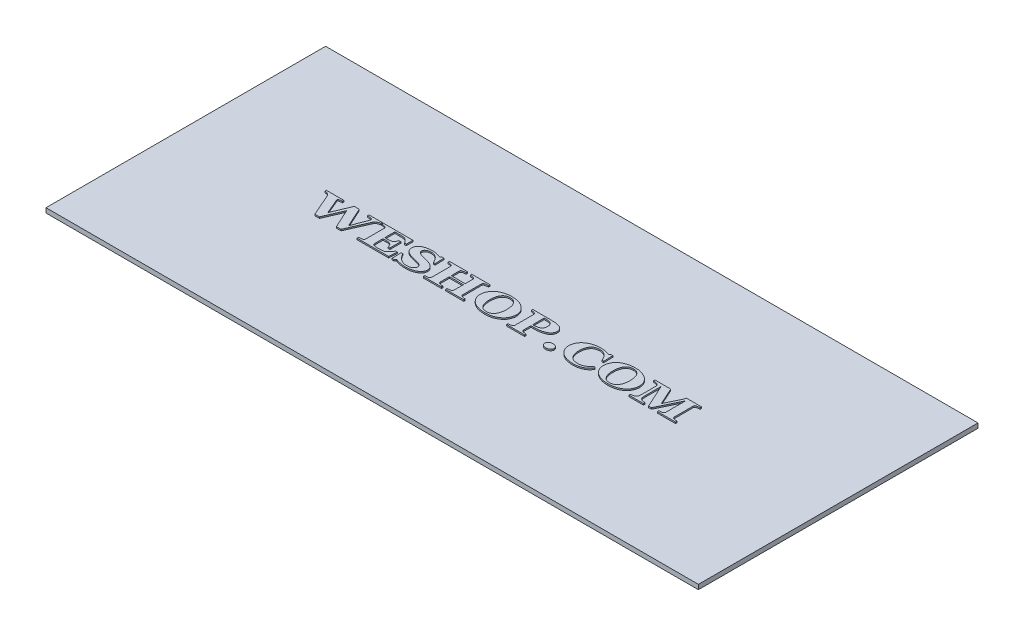
from build123d import *

# Parameters (mm, degrees)
SKETCH1_W           = 280
SKETCH1_H           = 120
BOSS_EXTRUDE1_DEPTH = 2
BOSS_EXTRUDE2_DEPTH = 0.6


with BuildPart() as part:
    # Sketch1 → Boss-Extrude1 (new body)
    with BuildSketch(Plane(origin=(0, 0, 0), x_dir=(1, 0, 0), z_dir=(0, 1, 0))):
        with Locations((140, -60)):
            Rectangle(SKETCH1_W, SKETCH1_H)
    extrude(amount=BOSS_EXTRUDE1_DEPTH)

    # Sketch2 → Boss-Extrude2 (add)
    # profile 1 of 10: a face of its own
    with BuildSketch(Plane(origin=(0, 2, 0), x_dir=(1, 0, 0), z_dir=(0, 1, 0))):
        with BuildLine():
            add(Edge.make_bspline(
                [(78.296345807, -54.573542626), (78.19170189, -54.583676123), (77.980579957, -54.604120726), (77.668920527, -54.677623876), (77.359581801, -54.773191934), (77.158089668, -54.853137048), (77.056621091, -54.893396272)],
                knots=[0, 0, 0, 0, 0.980207013, 1.977594164, 2.981545138, 4, 4, 4, 4], degree=3))
            add(Edge.make_bspline(
                [(77.056621091, -54.893396272), (76.984359369, -54.927926602), (76.847755627, -54.993202825), (76.663779532, -55.105272574), (76.51305197, -55.222978934), (76.356052923, -55.391506062), (76.196464255, -55.634099964), (76.09314004, -55.843175545), (76.038692699, -55.953349231)],
                knots=[0, 0, 0, 0, 0.953348986, 1.802213318, 2.560702209, 3.222929308, 4.536605213, 6, 6, 6, 6], degree=3))
            add(Edge.make_bspline(
                [(76.038692699, -55.953349231), (75.989723967, -56.060772137), (75.884707059, -56.291148155), (75.715505312, -56.658836058), (75.53384484, -57.074800246), (75.325517842, -57.531984178), (75.105673984, -58.037836914), (74.861690724, -58.586846817), (74.604006687, -59.183519282), (74.227320375, -60.040101273), (73.742001268, -61.153884631), (73.149788445, -62.519493643), (72.539826171, -63.90813351), (72.131029765, -64.843811427), (71.924954563, -65.315488802)],
                knots=[0, 0, 0, 0, 0.41560898, 0.891302853, 1.424835623, 2.013450459, 2.659925582, 3.366484378, 4.128418168, 4.947923124, 6.660664128, 8.405410429, 10.187959188, 12, 12, 12, 12], degree=3))
            Line((71.924954563, -65.315488802), (69.942795836, -65.315488802))
            Line((69.942795836, -65.315488802), (66.197940008, -57.146379985))
            Line((66.197940008, -57.146379985), (62.688888693, -65.315488802))
            Line((62.688888693, -65.315488802), (60.683382984, -65.315488802))
            add(Edge.make_bspline(
                [(60.683382984, -65.315488802), (60.547103242, -65.004234595), (60.282783017, -64.400544122), (59.899712077, -63.521658351), (59.540767966, -62.698025978), (59.20424388, -61.930394103), (58.893039784, -61.217830252), (58.609081088, -60.559506591), (58.347762022, -59.957081029), (58.10616264, -59.405362117), (57.884706489, -58.890464729), (57.675053737, -58.401972974), (57.471361843, -57.935618411), (57.277923163, -57.489543178), (57.092508596, -57.064271493), (56.919240754, -56.658455659), (56.74995085, -56.275643902), (56.64117349, -56.027311273), (56.588322434, -55.906655268)],
                knots=[0, 0, 0, 0, 1.5894048, 3.08271668, 4.484728808, 5.792105468, 7.003389139, 8.121922626, 9.145816145, 10.075071623, 10.939303108, 11.767683496, 12.561658084, 13.319780439, 14.042050678, 14.731810454, 15.383831737, 16, 16, 16, 16], degree=3))
            add(Edge.make_bspline(
                [(56.588322434, -55.906655268), (56.557006634, -55.838238037), (56.497616306, -55.708484948), (56.392020025, -55.53468263), (56.280881393, -55.389227578), (56.112068283, -55.234792858), (55.864945811, -55.060924134), (55.648073676, -54.943134767), (55.530704173, -54.879388084)],
                knots=[0, 0, 0, 0, 0.894735225, 1.696862872, 2.415752849, 3.064392373, 4.411272116, 6, 6, 6, 6], degree=3))
            add(Edge.make_bspline(
                [(55.530704173, -54.879388084), (55.437708308, -54.83431831), (55.251198931, -54.743927889), (54.942181253, -54.661303539), (54.605025275, -54.596642434), (54.366750695, -54.570922797), (54.239616098, -54.557199739)],
                knots=[0, 0, 0, 0, 0.924125451, 1.853394886, 2.854650058, 4, 4, 4, 4], degree=3))
            Line((54.239616098, -54.557199739), (54.239616098, -53.959517014))
            Line((54.239616098, -53.959517014), (61.860070851, -53.959517014))
            Line((61.860070851, -53.959517014), (61.860070851, -54.540856852))
            add(Edge.make_bspline(
                [(61.860070851, -54.540856852), (61.754236572, -54.551770461), (61.556505534, -54.572160444), (61.281297608, -54.600264376), (61.049654745, -54.634070659), (60.809372465, -54.672010722), (60.568845176, -54.718246513), (60.395176508, -54.768622433), (60.319170073, -54.790669554)],
                knots=[0, 0, 0, 0, 1.224859254, 2.288414434, 3.184177491, 3.919141096, 5.089308011, 6, 6, 6, 6], degree=3))
            add(Edge.make_bspline(
                [(60.319170073, -54.790669554), (60.268603823, -54.809973602), (60.185520938, -54.841691121), (60.095192488, -54.916068732), (60.061951348, -54.992095802), (60.057435605, -55.037966201), (60.055349183, -55.059159841)],
                knots=[0, 0, 0, 0, 1.603309103, 2.634317285, 3.369009448, 4, 4, 4, 4], degree=3))
            add(Edge.make_bspline(
                [(60.055349183, -55.059159841), (60.05724025, -55.095905159), (60.061027479, -55.169494749), (60.089419338, -55.279387792), (60.130958557, -55.393764719), (60.154688036, -55.475343061), (60.167414694, -55.519095376)],
                knots=[0, 0, 0, 0, 0.926777371, 1.856050556, 2.850151293, 4, 4, 4, 4], degree=3))
            add(Edge.make_bspline(
                [(60.167414694, -55.519095376), (60.189016425, -55.575202941), (60.236581041, -55.698745581), (60.319243819, -55.89994482), (60.417045347, -56.134752411), (60.529699371, -56.403776824), (60.655169435, -56.707864504), (60.797960246, -57.045135132), (60.953576208, -57.41702524), (61.127112072, -57.819161858), (61.310059615, -58.252495038), (61.506385015, -58.71123142), (61.712222319, -59.196238323), (61.928855865, -59.70585991), (62.155814134, -60.24218345), (62.393483861, -60.803158688), (62.640967741, -61.390272797), (62.810217066, -61.789348483), (62.896676828, -61.993213338)],
                knots=[0, 0, 0, 0, 0.410730394, 0.904382799, 1.485948501, 2.148491668, 2.896920366, 3.73328361, 4.650626823, 5.651029244, 6.725437531, 7.864068872, 9.059949004, 10.324944596, 11.647190671, 13.038552756, 14.487166633, 16, 16, 16, 16], degree=3))
            Line((62.896676828, -61.993213338), (66.260976858, -53.959517014))
            Line((66.260976858, -53.959517014), (68.399560361, -53.959517014))
            Line((68.399560361, -53.959517014), (72.209787737, -62.366765042))
            add(Edge.make_bspline(
                [(72.209787737, -62.366765042), (72.277439299, -62.201757253), (72.409562947, -61.879496677), (72.603782994, -61.408386681), (72.785958132, -60.960146206), (72.95606346, -60.534785074), (73.116999757, -60.133154755), (73.269858197, -59.754902589), (73.408930029, -59.398843048), (73.577647955, -58.96297059), (73.772710307, -58.455455985), (73.992668023, -57.88286683), (74.193163114, -57.356962452), (74.318946173, -57.021140277), (74.378722316, -56.861546811)],
                knots=[0, 0, 0, 0, 1.08496482, 2.118938687, 3.100130043, 4.028556175, 4.905989251, 5.732429276, 6.510531208, 7.231511265, 8.575909329, 9.818330675, 10.963200782, 12, 12, 12, 12], degree=3))
            add(Edge.make_bspline(
                [(74.378722316, -56.861546811), (74.410708253, -56.772078325), (74.472107909, -56.600336153), (74.558777909, -56.353991596), (74.633333958, -56.128739005), (74.699798965, -55.924667541), (74.755658047, -55.737848286), (74.792203441, -55.564412495), (74.818401426, -55.404712588), (74.82104834, -55.302061345), (74.822314964, -55.252939787)],
                knots=[0, 0, 0, 0, 1.360898477, 2.612357386, 3.740321149, 4.759068307, 5.686924029, 6.530838163, 7.296964009, 8, 8, 8, 8], degree=3))
            add(Edge.make_bspline(
                [(74.822314964, -55.252939787), (74.820304346, -55.225222417), (74.816259127, -55.16945704), (74.774658203, -55.092163219), (74.711021523, -55.022484281), (74.586381503, -54.935981189), (74.382738243, -54.840400166), (74.202220162, -54.78717262), (74.103227935, -54.75798378)],
                knots=[0, 0, 0, 0, 0.53364985, 1.073665529, 1.66155296, 2.352912766, 4.000015916, 6, 6, 6, 6], degree=3))
            add(Edge.make_bspline(
                [(74.103227935, -54.75798378), (74.05433533, -54.745665598), (73.949462928, -54.719243659), (73.779785704, -54.691390309), (73.590137279, -54.662005219), (73.318897623, -54.634295844), (72.993024572, -54.601685323), (72.73669237, -54.582431093), (72.618359913, -54.573542626)],
                knots=[0, 0, 0, 0, 0.605588244, 1.298959111, 2.064666104, 2.91144524, 4.574208501, 6, 6, 6, 6], degree=3))
            Line((72.618359913, -54.573542626), (72.618359913, -53.959517014))
            Line((72.618359913, -53.959517014), (78.296345807, -53.959517014))
            Line((78.296345807, -53.959517014), (78.296345807, -54.573542626))
        make_face()
    # profile 2 of 10: a face of its own
    with BuildSketch(Plane(origin=(0, 2, 0), x_dir=(1, 0, 0), z_dir=(0, 1, 0))):
        with BuildLine():
            Line((91.445365772, -56.798509961), (90.698262365, -56.798509961))
            add(Edge.make_bspline(
                [(90.698262365, -56.798509961), (90.643346078, -56.692599308), (90.528582389, -56.471267939), (90.294225709, -56.158327392), (90.0119703, -55.841638227), (89.68669684, -55.53355938), (89.339117957, -55.251072795), (88.979970494, -55.025348466), (88.61956469, -54.865020985), (88.373281452, -54.810236221), (88.253833405, -54.78366546)],
                knots=[0, 0, 0, 0, 0.875589548, 1.829801143, 2.862969625, 3.991781952, 5.119144108, 6.149283857, 7.102397592, 8, 8, 8, 8], degree=3))
            add(Edge.make_bspline(
                [(88.253833405, -54.78366546), (88.19862046, -54.77561075), (88.078353371, -54.758065653), (87.882332707, -54.73589765), (87.655393763, -54.727455109), (87.407981851, -54.7168672), (87.15728524, -54.714350906), (86.921519711, -54.708603713), (86.709046417, -54.70620685), (86.575185654, -54.706488016), (86.512148587, -54.706620421)],
                knots=[0, 0, 0, 0, 0.767441706, 1.671672812, 2.711280616, 3.889432351, 5.077702148, 6.158957075, 7.133024922, 8, 8, 8, 8], degree=3))
            Line((86.512148587, -54.706620421), (84.422593746, -54.706620421))
            Line((84.422593746, -54.706620421), (84.422593746, -59.039820182))
            Line((84.422593746, -59.039820182), (85.930808749, -59.039820182))
            add(Edge.make_bspline(
                [(85.930808749, -59.039820182), (86.0234444, -59.038312281), (86.204237159, -59.035369378), (86.469343444, -59.017170516), (86.720955858, -58.983994438), (86.961759733, -58.940631478), (87.192445863, -58.879477503), (87.409519728, -58.788513688), (87.618805365, -58.679639761), (87.745943177, -58.587030292), (87.810240757, -58.540194778)],
                knots=[0, 0, 0, 0, 1.121758445, 2.189284589, 3.21554309, 4.193278715, 5.151195179, 6.097921735, 7.03805934, 8, 8, 8, 8], degree=3))
            add(Edge.make_bspline(
                [(87.810240757, -58.540194778), (87.851004645, -58.505479097), (87.939796808, -58.429861177), (88.058272206, -58.283133164), (88.177367709, -58.10317711), (88.293928803, -57.898526684), (88.399162962, -57.683120572), (88.492006073, -57.476397089), (88.560686501, -57.282623273), (88.591723941, -57.156757009), (88.606372825, -57.097351323)],
                knots=[0, 0, 0, 0, 0.76780374, 1.672435061, 2.695637444, 3.867339834, 5.052247461, 6.138546219, 7.121441007, 8, 8, 8, 8], degree=3))
            Line((88.606372825, -57.097351323), (89.353476233, -57.097351323))
            Line((89.353476233, -57.097351323), (89.353476233, -61.729392448))
            Line((89.353476233, -61.729392448), (88.606372825, -61.729392448))
            add(Edge.make_bspline(
                [(88.606372825, -61.729392448), (88.592462155, -61.672333637), (88.562746727, -61.550446849), (88.495656422, -61.359822418), (88.403157777, -61.150210422), (88.293364814, -60.928968745), (88.17578898, -60.714641801), (88.054484773, -60.529464874), (87.937494189, -60.378554733), (87.850242639, -60.301063717), (87.810240757, -60.265536709)],
                knots=[0, 0, 0, 0, 0.834974965, 1.783640715, 2.869384691, 4.092121065, 5.296278034, 6.343183564, 7.240405754, 8, 8, 8, 8], degree=3))
            add(Edge.make_bspline(
                [(87.810240757, -60.265536709), (87.752093704, -60.222018947), (87.635061719, -60.13443119), (87.439420925, -60.029253905), (87.227609819, -59.948774446), (87.001874882, -59.884689387), (86.75903596, -59.842667957), (86.49972023, -59.809156022), (86.221334784, -59.791357948), (86.029665428, -59.788432459), (85.930808749, -59.786923589)],
                knots=[0, 0, 0, 0, 0.880724136, 1.772624527, 2.684854757, 3.62692315, 4.616349229, 5.673240146, 6.799934654, 8, 8, 8, 8], degree=3))
            Line((85.930808749, -59.786923589), (84.422593746, -59.786923589))
            Line((84.422593746, -59.786923589), (84.422593746, -62.950439579))
            add(Edge.make_bspline(
                [(84.422593746, -62.950439579), (84.424316627, -63.028273759), (84.427594085, -63.176338668), (84.4416352, -63.385756348), (84.472667686, -63.569954571), (84.512855027, -63.730635796), (84.571414538, -63.872146437), (84.655534816, -63.990572322), (84.754298549, -64.098376914), (84.836018816, -64.151362166), (84.877859884, -64.178490804)],
                knots=[0, 0, 0, 0, 1.357933266, 2.583212975, 3.656528218, 4.61129638, 5.468561396, 6.308128794, 7.133755904, 8, 8, 8, 8], degree=3))
            add(Edge.make_bspline(
                [(84.877859884, -64.178490804), (84.923991893, -64.202368068), (85.020472782, -64.252305187), (85.18543044, -64.304350315), (85.371412382, -64.345582575), (85.583783848, -64.375617761), (85.826994986, -64.395729759), (86.108136629, -64.408556813), (86.42880749, -64.418531726), (86.656112195, -64.418815225), (86.775969478, -64.418964713)],
                knots=[0, 0, 0, 0, 0.644712725, 1.348357864, 2.14166198, 3.011823986, 4.012088146, 5.17447126, 6.510104761, 8, 8, 8, 8], degree=3))
            add(Edge.make_bspline(
                [(86.775969478, -64.418964713), (86.905935579, -64.418198341), (87.189220138, -64.416527893), (87.628217893, -64.413677113), (88.073059241, -64.400657171), (88.363633015, -64.376512692), (88.498976711, -64.365266656)],
                knots=[0, 0, 0, 0, 0.904404789, 1.971313355, 3.055076641, 4, 4, 4, 4], degree=3))
            add(Edge.make_bspline(
                [(88.498976711, -64.365266656), (88.63695599, -64.351493323), (88.903942908, -64.324842222), (89.226739776, -64.267735597), (89.462920432, -64.212947843), (89.614335169, -64.162716712), (89.742806047, -64.102872197), (89.81476452, -64.052594094), (89.84843224, -64.029070123)],
                knots=[0, 0, 0, 0, 1.775106705, 3.434793028, 4.193737967, 4.877587598, 5.474848982, 6, 6, 6, 6], degree=3))
            add(Edge.make_bspline(
                [(89.84843224, -64.029070123), (89.932752819, -63.959434312), (90.11300915, -63.810570346), (90.378234673, -63.546588054), (90.656403307, -63.232202277), (90.894986838, -62.943917291), (91.082834723, -62.700535041), (91.214985062, -62.525516748), (91.338373809, -62.3648739), (91.444142139, -62.213450947), (91.539010771, -62.075838284), (91.617261892, -61.949286617), (91.687058591, -61.836825124), (91.725883974, -61.763837879), (91.744207135, -61.729392448)],
                knots=[0, 0, 0, 0, 1.314273956, 2.809589354, 4.492650028, 6.360359299, 7.307374923, 8.18879324, 8.997213642, 9.742290776, 10.409246427, 11.006317793, 11.531043914, 12, 12, 12, 12], degree=3))
            Line((91.744207135, -61.729392448), (92.491310542, -61.729392448))
            Line((92.491310542, -61.729392448), (92.218150859, -65.16606812))
            Line((92.218150859, -65.16606812), (78.744607851, -65.16606812))
            Line((78.744607851, -65.16606812), (78.744607851, -64.568385395))
            add(Edge.make_bspline(
                [(78.744607851, -64.568385395), (78.795983685, -64.565461224), (78.906594956, -64.559165535), (79.084810152, -64.544770249), (79.287778834, -64.525185063), (79.506757518, -64.506482369), (79.72100022, -64.482478627), (79.909205856, -64.454103027), (80.063312626, -64.428080131), (80.15255913, -64.403970468), (80.192120703, -64.393283034)],
                knots=[0, 0, 0, 0, 0.845837944, 1.821074315, 2.938695738, 4.197612162, 5.433704078, 6.481185859, 7.326733553, 8, 8, 8, 8], degree=3))
            add(Edge.make_bspline(
                [(80.192120703, -64.393283034), (80.250979289, -64.371927569), (80.360908041, -64.332042488), (80.507562021, -64.258453715), (80.623465507, -64.174093469), (80.707844695, -64.077379389), (80.769329605, -63.970193166), (80.805954536, -63.850312292), (80.83466964, -63.719117318), (80.835867915, -63.626911034), (80.836497391, -63.57847338)],
                knots=[0, 0, 0, 0, 1.324026482, 2.472852086, 3.460790954, 4.335952139, 5.169218041, 6.054390195, 6.977935448, 8, 8, 8, 8], degree=3))
            Line((80.836497391, -63.57847338), (80.836497391, -55.642834378))
            add(Edge.make_bspline(
                [(80.836497391, -55.642834378), (80.835168531, -55.597633551), (80.832587066, -55.509825664), (80.812509853, -55.384651153), (80.775974451, -55.271972791), (80.727752782, -55.16686358), (80.647417608, -55.070886444), (80.530559461, -54.984231231), (80.375212044, -54.904427257), (80.256472205, -54.859420435), (80.192120703, -54.835028819)],
                knots=[0, 0, 0, 0, 0.959637119, 1.864207241, 2.679397824, 3.470106691, 4.303678005, 5.305082028, 6.539479088, 8, 8, 8, 8], degree=3))
            add(Edge.make_bspline(
                [(80.192120703, -54.835028819), (80.144055755, -54.818832086), (80.040336739, -54.783881269), (79.868898157, -54.741757838), (79.672660351, -54.695326154), (79.457446635, -54.660754409), (79.245478221, -54.622717214), (79.052727073, -54.596589708), (78.889791232, -54.57082107), (78.789798616, -54.561439607), (78.744607851, -54.557199739)],
                knots=[0, 0, 0, 0, 0.824078335, 1.778272909, 2.867691918, 4.100958234, 5.319605997, 6.367931021, 7.262401087, 8, 8, 8, 8], degree=3))
            Line((78.744607851, -54.557199739), (78.744607851, -53.959517014))
            Line((78.744607851, -53.959517014), (91.445365772, -53.959517014))
            Line((91.445365772, -53.959517014), (91.445365772, -56.798509961))
        make_face()
    # profile 3 of 10: a face of its own
    with BuildSketch(Plane(origin=(0, 2, 0), x_dir=(1, 0, 0), z_dir=(0, 1, 0))):
        with BuildLine():
            add(Edge.make_bspline(
                [(99.591127608, -65.464909483), (99.372366142, -65.461636157), (98.941343991, -65.455186775), (98.306048555, -65.408259001), (97.69352622, -65.328985719), (97.107676575, -65.219933418), (96.556820684, -65.085495172), (96.043973183, -64.945440172), (95.576400197, -64.789910649), (95.283849801, -64.671753555), (95.143527638, -64.615079358)],
                knots=[0, 0, 0, 0, 1.152124944, 2.270012992, 3.352907771, 4.403620989, 5.406726421, 6.338538218, 7.203077778, 8, 8, 8, 8], degree=3))
            Line((95.143527638, -64.615079358), (94.433779401, -65.16606812))
            Line((94.433779401, -65.16606812), (93.686675994, -65.16606812))
            Line((93.686675994, -65.16606812), (93.537255312, -61.131709722))
            Line((93.537255312, -61.131709722), (94.28435872, -61.131709722))
            add(Edge.make_bspline(
                [(94.28435872, -61.131709722), (94.337100527, -61.230310344), (94.445692285, -61.43332225), (94.631328413, -61.734794771), (94.835254912, -62.046213344), (95.055379664, -62.36388913), (95.299578369, -62.67539392), (95.562670865, -62.973514123), (95.843353007, -63.256004406), (96.044322407, -63.42878375), (96.145113143, -63.51543653)],
                knots=[0, 0, 0, 0, 0.881715646, 1.815391927, 2.790841325, 3.817598912, 4.862468163, 5.910433437, 6.952034727, 8, 8, 8, 8], degree=3))
            add(Edge.make_bspline(
                [(96.145113143, -63.51543653), (96.253569593, -63.601984545), (96.47004796, -63.774733819), (96.818992243, -64.003916386), (97.185520344, -64.209418112), (97.572543429, -64.391235319), (97.986531871, -64.542614179), (98.434861857, -64.641280813), (98.914447669, -64.707130652), (99.245353156, -64.714173543), (99.416025247, -64.717806076)],
                knots=[0, 0, 0, 0, 0.934496911, 1.865249746, 2.808983601, 3.763738544, 4.743942547, 5.771688259, 6.850697136, 8, 8, 8, 8], degree=3))
            add(Edge.make_bspline(
                [(99.416025247, -64.717806076), (99.531253119, -64.715947007), (99.755000479, -64.712337101), (100.080075445, -64.686421457), (100.38419174, -64.644850065), (100.667929042, -64.587648444), (100.930161536, -64.510398289), (101.172229, -64.416629571), (101.394490642, -64.308247399), (101.594071301, -64.181019888), (101.771332883, -64.041413284), (101.925977525, -63.891706016), (102.058460917, -63.734356454), (102.167626207, -63.568094715), (102.248955453, -63.390295521), (102.310890646, -63.206012352), (102.346526299, -63.01173132), (102.350868666, -62.879761346), (102.353075516, -62.812692388)],
                knots=[0, 0, 0, 0, 1.416483248, 2.750501088, 4.006120948, 5.188219803, 6.305306514, 7.362443371, 8.376491055, 9.339946331, 10.266349362, 11.145920383, 11.981352355, 12.790740197, 13.582578405, 14.378279683, 15.175819408, 16, 16, 16, 16], degree=3))
            add(Edge.make_bspline(
                [(102.353075516, -62.812692388), (102.351550667, -62.757284348), (102.348541303, -62.647933937), (102.316479362, -62.488027486), (102.267378819, -62.335185273), (102.199524344, -62.18846727), (102.108476778, -62.050585209), (102.002095306, -61.916077946), (101.870658245, -61.793196534), (101.723788257, -61.672532855), (101.553466631, -61.56226656), (101.366238663, -61.450749696), (101.155163809, -61.346371159), (100.922387448, -61.247307576), (100.668786398, -61.150536842), (100.393063135, -61.06116407), (100.096955337, -60.971376002), (99.890964154, -60.918473295), (99.784907554, -60.891235813)],
                knots=[0, 0, 0, 0, 0.768888759, 1.517438646, 2.256004801, 2.996073152, 3.754860625, 4.546818165, 5.372666404, 6.249061057, 7.184682039, 8.187895588, 9.275859652, 10.452809303, 11.701849237, 13.045576074, 14.478885606, 16, 16, 16, 16], degree=3))
            add(Edge.make_bspline(
                [(99.784907554, -60.891235813), (99.644752638, -60.856504384), (99.3704867, -60.788539248), (98.969022901, -60.683872823), (98.58305238, -60.589554327), (98.099020228, -60.46711523), (97.525251078, -60.313921249), (97.077188457, -60.182359939), (96.859530776, -60.118450726)],
                knots=[0, 0, 0, 0, 0.858905485, 1.680772416, 2.467822557, 3.222315422, 4.650669897, 6, 6, 6, 6], degree=3))
            add(Edge.make_bspline(
                [(96.859530776, -60.118450726), (96.741468205, -60.081084654), (96.510798021, -60.008078969), (96.182390381, -59.875319372), (95.874412066, -59.736939241), (95.591755019, -59.582165432), (95.331544309, -59.4166121), (95.094756204, -59.238921448), (94.881212498, -59.049483126), (94.691603615, -58.84843247), (94.525769736, -58.637341837), (94.380674989, -58.420713591), (94.257734374, -58.197698912), (94.160167589, -57.967992635), (94.082255211, -57.733066242), (94.025710581, -57.49178489), (93.992818466, -57.243790507), (93.987960061, -57.076433491), (93.985517357, -56.992289907)],
                knots=[0, 0, 0, 0, 1.299631077, 2.539214053, 3.716482159, 4.842625714, 5.919217645, 6.951976344, 7.947375936, 8.912642546, 9.849266912, 10.762506258, 11.647380876, 12.518531549, 13.378925674, 14.243036087, 15.116635538, 16, 16, 16, 16], degree=3))
            add(Edge.make_bspline(
                [(93.985517357, -56.992289907), (93.989927065, -56.884492622), (93.998744293, -56.66895156), (94.073087688, -56.350973153), (94.187730795, -56.039577479), (94.35125237, -55.73750947), (94.557508586, -55.445369328), (94.806846566, -55.166980123), (95.097660648, -54.903426397), (95.316112318, -54.748745816), (95.428360812, -54.66926525)],
                knots=[0, 0, 0, 0, 0.907528104, 1.814605746, 2.738134322, 3.697691636, 4.700374989, 5.745660546, 6.841637564, 8, 8, 8, 8], degree=3))
            add(Edge.make_bspline(
                [(95.428360812, -54.66926525), (95.547660642, -54.596012336), (95.795234203, -54.443996322), (96.208622752, -54.255700194), (96.665265521, -54.082820092), (97.166610878, -53.935602763), (97.701716279, -53.811785345), (98.26495274, -53.723561576), (98.850845005, -53.672183644), (99.248603339, -53.664557195), (99.451045719, -53.660675651)],
                knots=[0, 0, 0, 0, 0.799329831, 1.658786362, 2.590488543, 3.588094557, 4.642084917, 5.727095887, 6.843186733, 8, 8, 8, 8], degree=3))
            add(Edge.make_bspline(
                [(99.451045719, -53.660675651), (99.649575878, -53.663982517), (100.040188815, -53.670488856), (100.616630546, -53.71689125), (101.173072323, -53.799197712), (101.703860681, -53.910552748), (102.195578242, -54.040397174), (102.640512333, -54.162485359), (103.026894278, -54.293866626), (103.263154792, -54.387471794), (103.373338607, -54.431126039)],
                knots=[0, 0, 0, 0, 1.184822383, 2.331166977, 3.448473894, 4.539750316, 5.565999521, 6.483425153, 7.292721415, 8, 8, 8, 8], degree=3))
            Line((103.373338607, -54.431126039), (103.996703012, -53.959517014))
            Line((103.996703012, -53.959517014), (104.743806419, -53.959517014))
            Line((104.743806419, -53.959517014), (104.893227101, -57.844454731))
            Line((104.893227101, -57.844454731), (104.146123693, -57.844454731))
            add(Edge.make_bspline(
                [(104.146123693, -57.844454731), (104.035518083, -57.629228698), (103.808434653, -57.187349976), (103.487574829, -56.651441872), (103.208941379, -56.232081091), (102.992974102, -55.939605875), (102.76895464, -55.675868124), (102.608733882, -55.518754642), (102.530512576, -55.442050337)],
                knots=[0, 0, 0, 0, 1.497110148, 3.073704008, 3.861717738, 4.611997961, 5.32236413, 6, 6, 6, 6], degree=3))
            add(Edge.make_bspline(
                [(102.530512576, -55.442050337), (102.443872372, -55.365739475), (102.270489563, -55.213027557), (101.986440154, -55.012417623), (101.683027741, -54.836472008), (101.359715701, -54.683614397), (101.011969774, -54.557942363), (100.63609966, -54.46975585), (100.23145595, -54.418860119), (99.952375648, -54.41155271), (99.808254536, -54.407779058)],
                knots=[0, 0, 0, 0, 0.927643435, 1.856383276, 2.789936198, 3.74428405, 4.727798115, 5.756651058, 6.841502102, 8, 8, 8, 8], degree=3))
            add(Edge.make_bspline(
                [(99.808254536, -54.407779058), (99.717141779, -54.408841242), (99.538491782, -54.410923928), (99.277394867, -54.43551241), (99.029060047, -54.47155729), (98.794037909, -54.52545885), (98.571936115, -54.595984355), (98.361619672, -54.679448226), (98.163662788, -54.778049628), (97.980624873, -54.891222542), (97.815548482, -55.017080999), (97.669684478, -55.149588587), (97.54688658, -55.290301397), (97.447851471, -55.438955676), (97.370083369, -55.59419144), (97.312710187, -55.757025736), (97.280120161, -55.927928487), (97.275230735, -56.044272533), (97.272772348, -56.102769913)],
                knots=[0, 0, 0, 0, 1.293592571, 2.536420991, 3.721280179, 4.855409281, 5.956528112, 7.027900467, 8.065914499, 9.093400854, 10.079325245, 11.010184266, 11.8877447, 12.724618368, 13.540200822, 14.347654344, 15.169206374, 16, 16, 16, 16], degree=3))
            add(Edge.make_bspline(
                [(97.272772348, -56.102769913), (97.274520773, -56.158143079), (97.277966928, -56.267283889), (97.306572092, -56.426591957), (97.353650615, -56.577983548), (97.419796556, -56.72141935), (97.504442033, -56.858528127), (97.610130299, -56.985944705), (97.733021453, -57.106374756), (97.875081812, -57.219033387), (98.036984417, -57.326313806), (98.219231683, -57.42839554), (98.422632142, -57.526440163), (98.645505443, -57.624625399), (98.891117638, -57.717650472), (99.157335692, -57.805092364), (99.443500958, -57.892645382), (99.642305249, -57.94550169), (99.745217686, -57.972863129)],
                knots=[0, 0, 0, 0, 0.793918313, 1.564817285, 2.313404653, 3.0627409, 3.824859044, 4.618227688, 5.431380255, 6.289212798, 7.215037694, 8.214845509, 9.283351791, 10.45320269, 11.70762866, 13.04919743, 14.47249632, 16, 16, 16, 16], degree=3))
            add(Edge.make_bspline(
                [(99.745217686, -57.972863129), (99.996528301, -58.038458761), (100.504441096, -58.171031199), (101.139269137, -58.333069345), (101.640922232, -58.464165473), (101.998762536, -58.554759244), (102.332150703, -58.65276094), (102.547620329, -58.715351633), (102.651916879, -58.745648215)],
                knots=[0, 0, 0, 0, 1.554303501, 3.141334223, 3.920739819, 4.657236228, 5.35004468, 6, 6, 6, 6], degree=3))
            add(Edge.make_bspline(
                [(102.651916879, -58.745648215), (102.770603591, -58.782595915), (103.002888731, -58.854907308), (103.336647182, -58.980847884), (103.647815184, -59.119282246), (103.937536393, -59.265520436), (104.20549784, -59.422317119), (104.451462993, -59.590584084), (104.675699683, -59.769875842), (104.877959575, -59.960302455), (105.059067448, -60.160174545), (105.21297855, -60.374155015), (105.346014881, -60.59763389), (105.453132058, -60.834360076), (105.53744028, -61.083053545), (105.598570812, -61.343252412), (105.633764474, -61.615574973), (105.638116617, -61.800888798), (105.640330508, -61.895156016)],
                knots=[0, 0, 0, 0, 1.270620538, 2.486767613, 3.644381254, 4.750973376, 5.803022515, 6.815956909, 7.795081247, 8.73501933, 9.653429778, 10.547816205, 11.425196449, 12.30818623, 13.198849208, 14.105885713, 15.036483742, 16, 16, 16, 16], degree=3))
            add(Edge.make_bspline(
                [(105.640330508, -61.895156016), (105.634698134, -62.01544531), (105.623378301, -62.257200369), (105.538117093, -62.615642155), (105.397975752, -62.967290117), (105.204050967, -63.307848331), (104.963986615, -63.630764857), (104.683851068, -63.929366834), (104.364868908, -64.200896695), (104.127036289, -64.353170658), (104.006041805, -64.430638204)],
                knots=[0, 0, 0, 0, 0.915969168, 1.840896824, 2.791195352, 3.792238568, 4.818124311, 5.850161323, 6.906295436, 8, 8, 8, 8], degree=3))
            add(Edge.make_bspline(
                [(104.006041805, -64.430638204), (103.864841661, -64.510807642), (103.578169881, -64.673571752), (103.116637354, -64.878172398), (102.623891594, -65.054462957), (102.098101764, -65.205601336), (101.533080066, -65.322166871), (100.92542598, -65.404305764), (100.273009415, -65.456973264), (99.82314789, -65.462209068), (99.591127608, -65.464909483)],
                knots=[0, 0, 0, 0, 0.848498532, 1.722665284, 2.635164344, 3.583035478, 4.580502671, 5.648471037, 6.787176977, 8, 8, 8, 8], degree=3))
        make_face()
    # profile 4 of 10: a face of its own
    with BuildSketch(Plane(origin=(0, 2, 0), x_dir=(1, 0, 0), z_dir=(0, 1, 0))):
        with BuildLine():
            Line((124.467336367, -65.16606812), (116.697460933, -65.16606812))
            Line((116.697460933, -65.16606812), (116.697460933, -64.568385395))
            add(Edge.make_bspline(
                [(116.697460933, -64.568385395), (116.744936858, -64.565329896), (116.85001414, -64.558567236), (117.021904331, -64.546117412), (117.223662929, -64.535929893), (117.443074953, -64.519574869), (117.658886406, -64.502893786), (117.848177619, -64.482367037), (118.000295463, -64.459732413), (118.086776111, -64.434488581), (118.123961501, -64.42363411)],
                knots=[0, 0, 0, 0, 0.79497595, 1.759500451, 2.879772905, 4.17042906, 5.436144885, 6.495988718, 7.35329756, 8, 8, 8, 8], degree=3))
            add(Edge.make_bspline(
                [(118.123961501, -64.42363411), (118.182847463, -64.40320105), (118.293054048, -64.364960055), (118.440742918, -64.290938253), (118.556644823, -64.203601034), (118.647548262, -64.107933762), (118.711736228, -63.997848778), (118.758888088, -63.876739416), (118.783808203, -63.740559405), (118.787452178, -63.646270108), (118.789350473, -63.597150965)],
                knots=[0, 0, 0, 0, 1.293611176, 2.421026434, 3.413180915, 4.293649211, 5.141638938, 6.0419021, 6.979946886, 8, 8, 8, 8], degree=3))
            Line((118.789350473, -63.597150965), (118.789350473, -59.637502908))
            Line((118.789350473, -59.637502908), (112.812523216, -59.637502908))
            Line((112.812523216, -59.637502908), (112.812523216, -63.508432436))
            add(Edge.make_bspline(
                [(112.812523216, -63.508432436), (112.81426357, -63.552947923), (112.817718502, -63.641319575), (112.846844872, -63.769357684), (112.891670198, -63.891806038), (112.95664153, -64.007102544), (113.04785389, -64.111720979), (113.164087996, -64.203461312), (113.307232784, -64.280186631), (113.412801159, -64.32057979), (113.468573395, -64.341919674)],
                knots=[0, 0, 0, 0, 0.932466562, 1.851122303, 2.73926797, 3.660239897, 4.608986042, 5.630973272, 6.748432768, 8, 8, 8, 8], degree=3))
            add(Edge.make_bspline(
                [(113.468573395, -64.341919674), (113.506602421, -64.353209717), (113.594411944, -64.379278576), (113.74429123, -64.412367663), (113.928683588, -64.448078099), (114.137689716, -64.480006214), (114.353128186, -64.512165253), (114.556291631, -64.537832904), (114.737633388, -64.557124308), (114.851466449, -64.564810414), (114.904412756, -64.568385395)],
                knots=[0, 0, 0, 0, 0.653774377, 1.509573676, 2.528568984, 3.749749837, 4.994358673, 6.119365326, 7.125274688, 8, 8, 8, 8], degree=3))
            Line((114.904412756, -64.568385395), (114.904412756, -65.16606812))
            Line((114.904412756, -65.16606812), (107.134537322, -65.16606812))
            Line((107.134537322, -65.16606812), (107.134537322, -64.568385395))
            add(Edge.make_bspline(
                [(107.134537322, -64.568385395), (107.181228898, -64.566028545), (107.284742791, -64.560803477), (107.455376836, -64.552731534), (107.655125316, -64.534233098), (107.874095573, -64.518195865), (108.090575446, -64.495917999), (108.284430487, -64.470414695), (108.4454011, -64.444434083), (108.540145269, -64.420300217), (108.582050173, -64.409625921)],
                knots=[0, 0, 0, 0, 0.769435604, 1.705816819, 2.810941272, 4.070293336, 5.319246813, 6.391599999, 7.288612186, 8, 8, 8, 8], degree=3))
            add(Edge.make_bspline(
                [(108.582050173, -64.409625921), (108.638837158, -64.392027078), (108.745281934, -64.3590388), (108.88514198, -64.28440167), (109.00109982, -64.201511602), (109.086739745, -64.099611453), (109.150244903, -63.988356399), (109.195095416, -63.867681192), (109.220808105, -63.737537501), (109.224521221, -63.647849774), (109.226426862, -63.601820362)],
                knots=[0, 0, 0, 0, 1.264918193, 2.371035093, 3.36681418, 4.284877136, 5.184452693, 6.087695014, 7.018569463, 8, 8, 8, 8], degree=3))
            Line((109.226426862, -63.601820362), (109.226426862, -55.642834378))
            add(Edge.make_bspline(
                [(109.226426862, -55.642834378), (109.225297272, -55.598381032), (109.223100308, -55.511922707), (109.200081441, -55.388088012), (109.159361182, -55.2755966), (109.102271141, -55.171576921), (109.019780776, -55.074490356), (108.903751908, -54.988052683), (108.754784711, -54.909891287), (108.6424777, -54.865771731), (108.582050173, -54.842032913)],
                knots=[0, 0, 0, 0, 0.954666196, 1.856752036, 2.692686483, 3.516315951, 4.394358601, 5.40800497, 6.605359992, 8, 8, 8, 8], degree=3))
            add(Edge.make_bspline(
                [(108.582050173, -54.842032913), (108.530015586, -54.825345621), (108.418833229, -54.789689866), (108.239321245, -54.740387122), (108.035586954, -54.697156738), (107.818897479, -54.657494703), (107.607790352, -54.62202417), (107.421251982, -54.590954073), (107.267190808, -54.568889535), (107.175041013, -54.560769038), (107.134537322, -54.557199739)],
                knots=[0, 0, 0, 0, 0.887401595, 1.896111908, 3.021580394, 4.268447324, 5.473556682, 6.497901975, 7.339765046, 8, 8, 8, 8], degree=3))
            Line((107.134537322, -54.557199739), (107.134537322, -53.959517014))
            Line((107.134537322, -53.959517014), (114.904412756, -53.959517014))
            Line((114.904412756, -53.959517014), (114.904412756, -54.557199739))
            add(Edge.make_bspline(
                [(114.904412756, -54.557199739), (114.788343638, -54.565407223), (114.534551713, -54.583353366), (114.21297695, -54.626929764), (113.946049939, -54.664644213), (113.764208922, -54.695921328), (113.607315234, -54.722444907), (113.512086781, -54.743632838), (113.468573395, -54.753314384)],
                knots=[0, 0, 0, 0, 1.44378683, 3.156924463, 4.025659139, 4.789419493, 5.44684121, 6, 6, 6, 6], degree=3))
            add(Edge.make_bspline(
                [(113.468573395, -54.753314384), (113.407154499, -54.770825951), (113.292080863, -54.803635393), (113.141108492, -54.878449745), (113.02063894, -54.96762526), (112.913841016, -55.109486166), (112.832852387, -55.308071432), (112.819273588, -55.473975398), (112.812523216, -55.556450546)],
                knots=[0, 0, 0, 0, 1.012126342, 1.896306598, 2.662527516, 3.3669732, 4.691054352, 6, 6, 6, 6], degree=3))
            Line((112.812523216, -55.556450546), (112.812523216, -58.890399501))
            Line((112.812523216, -58.890399501), (118.789350473, -58.890399501))
            Line((118.789350473, -58.890399501), (118.789350473, -55.633495585))
            add(Edge.make_bspline(
                [(118.789350473, -55.633495585), (118.787190385, -55.589849844), (118.782992938, -55.505038187), (118.761085961, -55.382171632), (118.717171399, -55.270996658), (118.658931023, -55.16607959), (118.569680124, -55.073097214), (118.452471736, -54.984765565), (118.299263787, -54.908373657), (118.185040794, -54.863626297), (118.123961501, -54.839698215)],
                knots=[0, 0, 0, 0, 0.933176666, 1.813332904, 2.649876081, 3.476619248, 4.358813432, 5.379380245, 6.598656911, 8, 8, 8, 8], degree=3))
            add(Edge.make_bspline(
                [(118.123961501, -54.839698215), (118.075876926, -54.823585152), (117.972829547, -54.789054143), (117.804894013, -54.746046765), (117.614676491, -54.7044787), (117.410033972, -54.663461125), (117.204775829, -54.629413329), (117.016481121, -54.593662788), (116.849304594, -54.574254272), (116.745710649, -54.562618973), (116.697460933, -54.557199739)],
                knots=[0, 0, 0, 0, 0.835327211, 1.790143274, 2.854092526, 4.043537563, 5.228273554, 6.282286392, 7.199961028, 8, 8, 8, 8], degree=3))
            Line((116.697460933, -54.557199739), (116.697460933, -53.959517014))
            Line((116.697460933, -53.959517014), (124.467336367, -53.959517014))
            Line((124.467336367, -53.959517014), (124.467336367, -54.557199739))
            add(Edge.make_bspline(
                [(124.467336367, -54.557199739), (124.353646778, -54.564998236), (124.111847272, -54.581584388), (123.743402456, -54.622771922), (123.373390695, -54.676667821), (123.133963329, -54.730152071), (123.019823516, -54.755649082)],
                knots=[0, 0, 0, 0, 0.934748326, 1.988059648, 3.040867799, 4, 4, 4, 4], degree=3))
            add(Edge.make_bspline(
                [(123.019823516, -54.755649082), (122.960763483, -54.773234749), (122.849580503, -54.806340501), (122.703054419, -54.881126701), (122.586964974, -54.97073467), (122.502074138, -55.076338486), (122.449526088, -55.193148307), (122.40406477, -55.310735928), (122.382086899, -55.435814083), (122.377676494, -55.520594277), (122.375446827, -55.563454641)],
                knots=[0, 0, 0, 0, 1.309281841, 2.464777772, 3.478672645, 4.409792062, 5.313405234, 6.193491983, 7.08672547, 8, 8, 8, 8], degree=3))
            Line((122.375446827, -55.563454641), (122.375446827, -63.529444719))
            add(Edge.make_bspline(
                [(122.375446827, -63.529444719), (122.37758528, -63.575419413), (122.381709678, -63.66409006), (122.403573697, -63.79238548), (122.447964106, -63.907572822), (122.503112509, -64.01736911), (122.588567438, -64.115614337), (122.704600076, -64.202285704), (122.850617139, -64.281019242), (122.960893548, -64.323752887), (123.019823516, -64.346589071)],
                knots=[0, 0, 0, 0, 0.978187883, 1.886615088, 2.750105891, 3.593721562, 4.485428751, 5.487930011, 6.657589544, 8, 8, 8, 8], degree=3))
            add(Edge.make_bspline(
                [(123.019823516, -64.346589071), (123.063982469, -64.3605843), (123.160563712, -64.391193645), (123.322996876, -64.423249223), (123.511050452, -64.45905163), (123.719097782, -64.490143575), (123.929514985, -64.515925713), (124.126951222, -64.540807198), (124.303790362, -64.556628761), (124.415184733, -64.564636433), (124.467336367, -64.568385395)],
                knots=[0, 0, 0, 0, 0.757246994, 1.656195428, 2.704929967, 3.889655067, 5.096070299, 6.173016006, 7.144658742, 8, 8, 8, 8], degree=3))
            Line((124.467336367, -64.568385395), (124.467336367, -65.16606812))
        make_face()
    # profile 5 of 10: a face of its own
    with BuildSketch(Plane(origin=(0, 2, 0), x_dir=(1, 0, 0), z_dir=(0, 1, 0))):
        with BuildLine():
            add(Edge.make_bspline(
                [(139.06853858, -55.213249919), (139.236991183, -55.343099843), (139.570290512, -55.600020138), (140.019270647, -56.038750505), (140.407016276, -56.522004486), (140.690413946, -56.951650328), (140.883392659, -57.315354688), (141.009681385, -57.597463953), (141.115341094, -57.889418173), (141.201445571, -58.190619378), (141.269030252, -58.501806512), (141.318497268, -58.822146727), (141.346500939, -59.152156232), (141.350067848, -59.375187099), (141.351873368, -59.488082226)],
                knots=[0, 0, 0, 0, 1.51726198, 3.002045614, 4.467280966, 5.932474201, 6.667986893, 7.404002816, 8.136741566, 8.882192239, 9.638327977, 10.408212764, 11.194259408, 12, 12, 12, 12], degree=3))
            add(Edge.make_bspline(
                [(141.351873368, -59.488082226), (141.345749964, -59.68928797), (141.333571966, -60.08943841), (141.230566136, -60.681055623), (141.07053495, -61.25968223), (140.879202718, -61.725052509), (140.696197926, -62.085150381), (140.544248162, -62.347089984), (140.378103569, -62.599524832), (140.198226121, -62.843491747), (140.002282271, -63.07572264), (139.792585127, -63.299267866), (139.570090506, -63.514237252), (139.410265597, -63.647154275), (139.330024772, -63.713885873)],
                knots=[0, 0, 0, 0, 1.494474264, 2.972154379, 4.449936372, 5.949372042, 6.702118153, 7.451121674, 8.198694517, 8.947161854, 9.702547748, 10.45549383, 11.224573634, 12, 12, 12, 12], degree=3))
            add(Edge.make_bspline(
                [(139.330024772, -63.713885873), (139.152678549, -63.848135891), (138.795482217, -64.118531355), (138.207909705, -64.464521813), (137.575892333, -64.761167138), (137.018114872, -64.974961239), (136.546987519, -65.115890362), (136.173958697, -65.20993467), (135.784290442, -65.288408164), (135.377919668, -65.354682405), (134.954612824, -65.401622024), (134.514937196, -65.440586006), (134.058468612, -65.460759863), (133.748556015, -65.463512875), (133.591336727, -65.464909483)],
                knots=[0, 0, 0, 0, 1.307463458, 2.633386511, 4.001150672, 5.410718006, 6.142037712, 6.892531516, 7.672649143, 8.47937342, 9.313451145, 10.177124258, 11.075251447, 12, 12, 12, 12], degree=3))
            add(Edge.make_bspline(
                [(133.591336727, -65.464909483), (133.33590336, -65.459853215), (132.830938961, -65.449857515), (132.084837589, -65.374079041), (131.36032364, -65.247162129), (130.659646533, -65.074190349), (129.990528939, -64.850759715), (129.35932714, -64.581444311), (128.767333435, -64.26860558), (128.403789624, -64.019352075), (128.223865686, -63.895992328)],
                knots=[0, 0, 0, 0, 1.078727206, 2.132528117, 3.163589755, 4.183213442, 5.17794495, 6.1395463, 7.079230213, 8, 8, 8, 8], degree=3))
            add(Edge.make_bspline(
                [(128.223865686, -63.895992328), (128.056664108, -63.768005708), (127.72502, -63.514144416), (127.28416451, -63.074360433), (126.895530073, -62.596231674), (126.615180808, -62.167245444), (126.42579629, -61.80372738), (126.301636757, -61.523021312), (126.196694823, -61.235163729), (126.108770804, -60.940060957), (126.045454912, -60.63587718), (125.994815341, -60.325311863), (125.967021828, -60.006897774), (125.963380536, -59.792419953), (125.961543181, -59.684196871)],
                knots=[0, 0, 0, 0, 1.523253252, 3.021370806, 4.49538907, 5.978597492, 6.722072352, 7.46124301, 8.199231529, 8.93917493, 9.688477384, 10.447169907, 11.216459498, 12, 12, 12, 12], degree=3))
            add(Edge.make_bspline(
                [(125.961543181, -59.684196871), (125.963315135, -59.57129619), (125.966827905, -59.347478808), (125.995520785, -59.016126631), (126.042217419, -58.692619827), (126.107033678, -58.377413736), (126.192429292, -58.070815908), (126.29168074, -57.770406293), (126.413655237, -57.479067124), (126.553843705, -57.19629683), (126.711277254, -56.924117388), (126.878755186, -56.658382321), (127.063982239, -56.404346354), (127.262040304, -56.159806828), (127.472958365, -55.924147026), (127.700189978, -55.701823572), (127.93743736, -55.48429093), (128.107724429, -55.352181798), (128.19351461, -55.285625561)],
                knots=[0, 0, 0, 0, 1.058523883, 2.098446565, 3.116007157, 4.122120964, 5.113518943, 6.098882598, 7.086836905, 8.072416707, 9.056293061, 10.034061441, 11.016421138, 12.00224405, 12.984007276, 13.979907004, 14.982282421, 16, 16, 16, 16], degree=3))
            add(Edge.make_bspline(
                [(128.19351461, -55.285625561), (128.370811089, -55.158795116), (128.730120895, -54.90175999), (129.324606806, -54.582478121), (129.963505897, -54.304240597), (130.646205398, -54.072365703), (131.364381608, -53.888692789), (132.109552455, -53.756345815), (132.87819272, -53.674450912), (133.398130863, -53.665305839), (133.661377671, -53.660675651)],
                knots=[0, 0, 0, 0, 0.901143892, 1.82626208, 2.785179634, 3.782047817, 4.805883492, 5.849303765, 6.911093704, 8, 8, 8, 8], degree=3))
            add(Edge.make_bspline(
                [(133.661377671, -53.660675651), (133.923062032, -53.665440742), (134.439028957, -53.674836144), (135.200476929, -53.754384988), (135.937361232, -53.881295894), (136.645336315, -54.061631494), (137.319459697, -54.283836942), (137.949782614, -54.549371539), (138.53493988, -54.854344612), (138.892354523, -55.09474627), (139.06853858, -55.213249919)],
                knots=[0, 0, 0, 0, 1.099094419, 2.167100719, 3.212530274, 4.237802653, 5.233413539, 6.191599018, 7.108566403, 8, 8, 8, 8], degree=3))
        make_face()
        with BuildLine():
            add(Edge.make_bspline(
                [(136.47235424, -63.235272753), (136.543872653, -63.111938017), (136.68777473, -62.863776407), (136.864591852, -62.465350356), (137.012329495, -62.044757391), (137.125728403, -61.598217003), (137.211368687, -61.125241864), (137.273727048, -60.624894093), (137.311849435, -60.09414295), (137.315590417, -59.730956634), (137.31751497, -59.544114982)],
                knots=[0, 0, 0, 0, 0.891480345, 1.793746077, 2.722325316, 3.677734241, 4.67287732, 5.727967515, 6.831150061, 8, 8, 8, 8], degree=3))
            add(Edge.make_bspline(
                [(137.31751497, -59.544114982), (137.315165127, -59.382184698), (137.310505877, -59.061110595), (137.276412711, -58.582825953), (137.223696361, -58.111283983), (137.14731121, -57.648068891), (137.047093195, -57.200284909), (136.916020691, -56.774287034), (136.75430217, -56.373232036), (136.618696261, -56.123406971), (136.551733977, -56.000043194)],
                knots=[0, 0, 0, 0, 1.060179015, 2.102114665, 3.138064895, 4.16592562, 5.17459852, 6.140025662, 7.081543485, 8, 8, 8, 8], degree=3))
            add(Edge.make_bspline(
                [(136.551733977, -56.000043194), (136.477662418, -55.883471888), (136.331011757, -55.652678056), (136.059983944, -55.346363415), (135.759250894, -55.071842969), (135.478987873, -54.875702049), (135.238085579, -54.738749135), (135.045288322, -54.649566902), (134.841490481, -54.574621644), (134.625661414, -54.514991918), (134.400005693, -54.464591809), (134.162414314, -54.433899886), (133.915511928, -54.411413851), (133.747038668, -54.409004237), (133.661377671, -54.407779058)],
                knots=[0, 0, 0, 0, 1.431778197, 2.834707689, 4.230244144, 5.651200946, 6.374684996, 7.104814068, 7.853697431, 8.626048718, 9.427837345, 10.251588049, 11.111011964, 12, 12, 12, 12], degree=3))
            add(Edge.make_bspline(
                [(133.661377671, -54.407779058), (133.515630443, -54.411648827), (133.232034484, -54.419178649), (132.820209997, -54.482362423), (132.436908457, -54.591153857), (132.077814448, -54.737717663), (131.746950754, -54.931013276), (131.442150583, -55.166283268), (131.168980511, -55.447650658), (130.920197729, -55.766678129), (130.701279284, -56.125088007), (130.51260769, -56.520023009), (130.351001818, -56.9486522), (130.221856309, -57.413121284), (130.118445733, -57.912187716), (130.048760006, -58.446786276), (130.002591538, -59.01566008), (129.998173614, -59.406270251), (129.99590158, -59.607151832)],
                knots=[0, 0, 0, 0, 0.972031392, 1.891385363, 2.770739289, 3.625027614, 4.471899881, 5.319344919, 6.185805639, 7.081063909, 8.013389211, 8.981739047, 9.997173745, 11.065519199, 12.194768428, 13.39458551, 14.660096893, 16, 16, 16, 16], degree=3))
            add(Edge.make_bspline(
                [(129.99590158, -59.607151832), (129.997650126, -59.780008001), (130.001104789, -60.121525865), (130.043427032, -60.626323805), (130.105208982, -61.117467481), (130.192538132, -61.592000556), (130.30804388, -62.044227105), (130.452568922, -62.468666662), (130.626403428, -62.864635871), (130.770152307, -63.108146902), (130.841062309, -63.228268658)],
                knots=[0, 0, 0, 0, 1.101527239, 2.176325154, 3.226621051, 4.25598548, 5.249785926, 6.198864894, 7.111516589, 8, 8, 8, 8], degree=3))
            add(Edge.make_bspline(
                [(130.841062309, -63.228268658), (130.917473844, -63.341864773), (131.067774948, -63.565307758), (131.342372534, -63.857577633), (131.638290382, -64.117664531), (131.969523895, -64.335925745), (132.337546205, -64.506956872), (132.744006454, -64.631893699), (133.190399708, -64.702940196), (133.500809507, -64.712737926), (133.661377671, -64.717806076)],
                knots=[0, 0, 0, 0, 0.981243125, 1.930100279, 2.868689742, 3.804532132, 4.766698348, 5.772132222, 6.847572986, 8, 8, 8, 8], degree=3))
            add(Edge.make_bspline(
                [(133.661377671, -64.717806076), (133.819640774, -64.712802684), (134.126234286, -64.703109917), (134.569788545, -64.630394912), (134.978763619, -64.507718559), (135.35165869, -64.332232531), (135.68883733, -64.114737642), (135.989328976, -63.858058005), (136.255970519, -63.566541258), (136.399767839, -63.34639751), (136.47235424, -63.235272753)],
                knots=[0, 0, 0, 0, 1.139597202, 2.207672553, 3.227282917, 4.205287738, 5.166195097, 6.108612216, 7.045260148, 8, 8, 8, 8], degree=3))
        make_face(mode=Mode.SUBTRACT)
    # profile 6 of 10: a face of its own
    with BuildSketch(Plane(origin=(0, 2, 0), x_dir=(1, 0, 0), z_dir=(0, 1, 0))):
        with BuildLine():
            add(Edge.make_bspline(
                [(156.29394151, -56.782167074), (156.29281703, -56.860054422), (156.290596517, -57.013858763), (156.266299235, -57.240919394), (156.227924636, -57.459813843), (156.169723353, -57.669794373), (156.101838913, -57.872293151), (156.013897027, -58.065606429), (155.910543504, -58.249947674), (155.755262274, -58.487697089), (155.52069891, -58.760237152), (155.19728571, -59.05845736), (154.824932454, -59.323071776), (154.550182817, -59.467834943), (154.409840105, -59.541780284)],
                knots=[0, 0, 0, 0, 0.79158873, 1.563152243, 2.318976272, 3.048328086, 3.776477198, 4.48827891, 5.203765103, 5.923569506, 7.372281895, 8.845016667, 10.388427658, 12, 12, 12, 12], degree=3))
            add(Edge.make_bspline(
                [(154.409840105, -59.541780284), (154.253781468, -59.613856854), (153.936069808, -59.760593792), (153.427981221, -59.931644059), (152.890795865, -60.08070503), (152.319082879, -60.192945586), (151.714110286, -60.278288353), (151.07464406, -60.34101437), (150.39851237, -60.378834221), (149.935830329, -60.382648919), (149.698419244, -60.384606315)],
                knots=[0, 0, 0, 0, 0.854254474, 1.739132236, 2.662020523, 3.625153872, 4.633829983, 5.699346691, 6.81949039, 8, 8, 8, 8], degree=3))
            Line((149.698419244, -60.384606315), (148.524066076, -60.384606315))
            Line((148.524066076, -60.384606315), (148.524066076, -63.51543653))
            add(Edge.make_bspline(
                [(148.524066076, -63.51543653), (148.525963513, -63.561462544), (148.529660646, -63.65114365), (148.555292057, -63.780350031), (148.598898062, -63.89927394), (148.655929846, -64.012284432), (148.744480576, -64.113855791), (148.863564144, -64.201890207), (149.013155775, -64.278739061), (149.125073697, -64.318416001), (149.184785652, -64.339584976)],
                knots=[0, 0, 0, 0, 0.961191577, 1.872869628, 2.736632409, 3.601923162, 4.501053918, 5.521830253, 6.677813534, 8, 8, 8, 8], degree=3))
            add(Edge.make_bspline(
                [(149.184785652, -64.339584976), (149.223571854, -64.350978851), (149.311296164, -64.376748835), (149.460831084, -64.406969662), (149.641006277, -64.443268673), (149.845318085, -64.475455029), (150.056812788, -64.508051119), (150.259429158, -64.532568642), (150.443670943, -64.555025148), (150.560663437, -64.564097624), (150.615955616, -64.568385395)],
                knots=[0, 0, 0, 0, 0.668244188, 1.511394689, 2.521005499, 3.70797056, 4.93108533, 6.059681094, 7.082979957, 8, 8, 8, 8], degree=3))
            Line((150.615955616, -64.568385395), (150.615955616, -65.16606812))
            Line((150.615955616, -65.16606812), (142.846080182, -65.16606812))
            Line((142.846080182, -65.16606812), (142.846080182, -64.568385395))
            add(Edge.make_bspline(
                [(142.846080182, -64.568385395), (142.898985062, -64.563536439), (143.011745983, -64.553201423), (143.193315688, -64.540523096), (143.397828355, -64.520658858), (143.617425049, -64.501216873), (143.830972204, -64.480034303), (144.017855804, -64.454534639), (144.168791445, -64.428407737), (144.255595292, -64.403977284), (144.293593033, -64.393283034)],
                knots=[0, 0, 0, 0, 0.873284973, 1.861310698, 2.991712734, 4.250675371, 5.48542177, 6.518468884, 7.351470717, 8, 8, 8, 8], degree=3))
            add(Edge.make_bspline(
                [(144.293593033, -64.393283034), (144.35389081, -64.371747791), (144.465643923, -64.331835368), (144.615578167, -64.26157585), (144.729723989, -64.179280066), (144.815660482, -64.088783331), (144.87217663, -63.983389954), (144.912083026, -63.864272236), (144.935060418, -63.727213342), (144.936963333, -63.629925646), (144.937969722, -63.57847338)],
                knots=[0, 0, 0, 0, 1.34574222, 2.494136453, 3.465749578, 4.287610318, 5.093032182, 5.95678962, 6.919413177, 8, 8, 8, 8], degree=3))
            Line((144.937969722, -63.57847338), (144.937969722, -55.642834378))
            add(Edge.make_bspline(
                [(144.937969722, -55.642834378), (144.936878836, -55.598360581), (144.934738359, -55.511096584), (144.910634767, -55.385601418), (144.873533963, -55.268833756), (144.818674437, -55.160350281), (144.739401329, -55.057649866), (144.622325652, -54.968823947), (144.470680054, -54.890643561), (144.355642688, -54.848449144), (144.293593033, -54.825690026)],
                knots=[0, 0, 0, 0, 0.939473792, 1.843382975, 2.691791271, 3.523592535, 4.402736533, 5.410384703, 6.603195299, 8, 8, 8, 8], degree=3))
            add(Edge.make_bspline(
                [(144.293593033, -54.825690026), (144.243213289, -54.809381671), (144.135695934, -54.774577381), (143.958584274, -54.735016533), (143.759878995, -54.691605769), (143.544966585, -54.65808406), (143.335059447, -54.623279698), (143.145620157, -54.596722558), (142.986598032, -54.570894302), (142.889714373, -54.561452232), (142.846080182, -54.557199739)],
                knots=[0, 0, 0, 0, 0.861583529, 1.838738631, 2.951879607, 4.17238276, 5.378333546, 6.415720807, 7.286476783, 8, 8, 8, 8], degree=3))
            Line((142.846080182, -54.557199739), (142.846080182, -53.959517014))
            Line((142.846080182, -53.959517014), (150.763041599, -53.959517014))
            add(Edge.make_bspline(
                [(150.763041599, -53.959517014), (150.987214254, -53.961792586), (151.421799396, -53.966204053), (152.051864938, -53.999044064), (152.638461722, -54.051820031), (153.181115107, -54.125153471), (153.679744977, -54.221849791), (154.133172205, -54.343771256), (154.545106467, -54.482001389), (154.912550735, -54.645261345), (155.239320211, -54.829317719), (155.520881252, -55.039868049), (155.760479803, -55.273128416), (155.957253645, -55.52948025), (156.107607608, -55.8108155), (156.216088763, -56.114275481), (156.283153027, -56.440705376), (156.290292176, -56.666663553), (156.29394151, -56.782167074)],
                knots=[0, 0, 0, 0, 1.552718587, 3.010128201, 4.368830317, 5.631283327, 6.80158376, 7.884270383, 8.881526141, 9.808155846, 10.665324544, 11.473910293, 12.236290365, 12.974818356, 13.703184133, 14.436381149, 15.200721632, 16, 16, 16, 16], degree=3))
        make_face()
        with BuildLine():
            add(Edge.make_bspline(
                [(152.409003793, -57.200078042), (152.407773084, -57.098019311), (152.405379904, -56.899560644), (152.370817706, -56.612511279), (152.321191806, -56.344920671), (152.248811896, -56.098341916), (152.15562459, -55.872429405), (152.040033089, -55.667293314), (151.904497935, -55.481469958), (151.745459003, -55.315524307), (151.560940065, -55.16763921), (151.342566683, -55.044522005), (151.093874877, -54.940271992), (150.81314162, -54.853760288), (150.500450194, -54.787835503), (150.155025368, -54.738556501), (149.777450812, -54.711725431), (149.51479651, -54.70836393), (149.378565598, -54.706620421)],
                knots=[0, 0, 0, 0, 1.07655157, 2.093412176, 3.047099756, 3.946386761, 4.800655512, 5.620834728, 6.425860651, 7.221783277, 8.040233111, 8.912362526, 9.858271441, 10.881910641, 12.008084524, 13.227819501, 14.56215309, 16, 16, 16, 16], degree=3))
            Line((149.378565598, -54.706620421), (148.524066076, -54.706620421))
            Line((148.524066076, -54.706620421), (148.524066076, -59.637502908))
            Line((148.524066076, -59.637502908), (148.955985234, -59.637502908))
            add(Edge.make_bspline(
                [(148.955985234, -59.637502908), (149.093006534, -59.635852119), (149.358015061, -59.632659382), (149.743037582, -59.604118895), (150.102540093, -59.558366075), (150.437368713, -59.493628045), (150.747228204, -59.40946887), (151.032278857, -59.308221102), (151.291677882, -59.18572039), (151.526082574, -59.045785341), (151.73627675, -58.887898708), (151.915743513, -58.705074031), (152.067841577, -58.502894761), (152.196309853, -58.282210788), (152.291330542, -58.039262173), (152.358408043, -57.777322822), (152.401786051, -57.495682261), (152.406548465, -57.300636567), (152.409003793, -57.200078042)],
                knots=[0, 0, 0, 0, 1.36816297, 2.646120361, 3.853004745, 4.985453895, 6.048778718, 7.056698633, 8.002287975, 8.908609896, 9.779068982, 10.619880669, 11.457669914, 12.300167998, 13.16173483, 14.053342865, 14.99637379, 16, 16, 16, 16], degree=3))
        make_face(mode=Mode.SUBTRACT)
    # profile 7 of 10: a face of its own
    with BuildSketch(Plane(origin=(0, 2, 0), x_dir=(1, 0, 0), z_dir=(0, 1, 0))):
        with BuildLine():
            add(Edge.make_bspline(
                [(161.971927404, -63.902996423), (161.970212684, -63.955272201), (161.966834441, -64.058262933), (161.937489528, -64.20966024), (161.890643062, -64.355563966), (161.824393166, -64.496519541), (161.740249655, -64.632439474), (161.635799011, -64.761569858), (161.51356875, -64.885585557), (161.327693917, -65.043087169), (161.067856293, -65.212396248), (160.722608211, -65.358661344), (160.350228018, -65.450992148), (160.091485831, -65.460206339), (159.959417601, -65.464909483)],
                knots=[0, 0, 0, 0, 0.668584188, 1.317206124, 1.966133942, 2.62567825, 3.305666897, 4.007272934, 4.746882808, 5.531286392, 7.122731191, 8.69359258, 10.312330198, 12, 12, 12, 12], degree=3))
            add(Edge.make_bspline(
                [(159.959417601, -65.464909483), (159.825821854, -65.460104239), (159.565758308, -65.450750134), (159.190061494, -65.360744446), (158.843192147, -65.215728091), (158.582552886, -65.047008208), (158.395353168, -64.892534338), (158.27293079, -64.768374072), (158.169965264, -64.63732446), (158.084994093, -64.501267816), (158.018911102, -64.360207595), (157.97164835, -64.213626028), (157.942720106, -64.060563262), (157.939303174, -63.956042835), (157.937569006, -63.902996423)],
                knots=[0, 0, 0, 0, 1.700226597, 3.309738258, 4.892127956, 6.471374994, 7.24603097, 7.982471962, 8.688844132, 9.365919347, 10.022637817, 10.668785283, 11.324379298, 12, 12, 12, 12], degree=3))
            add(Edge.make_bspline(
                [(157.937569006, -63.902996423), (157.93932838, -63.850727178), (157.942820368, -63.746983706), (157.971978531, -63.59402315), (158.018901555, -63.445845796), (158.084500296, -63.302973048), (158.169213711, -63.166481526), (158.274444216, -63.037380744), (158.395042856, -62.910969987), (158.582556167, -62.753776105), (158.842350501, -62.580867925), (159.189618019, -62.433049217), (159.565893011, -62.344263907), (159.825849326, -62.332909293), (159.959417601, -62.327075173)],
                knots=[0, 0, 0, 0, 0.664077163, 1.318053705, 1.972030247, 2.636107411, 3.311512154, 4.008388561, 4.750107393, 5.529223197, 7.115349291, 8.697706171, 10.303246865, 12, 12, 12, 12], degree=3))
            add(Edge.make_bspline(
                [(159.959417601, -62.327075173), (160.091454537, -62.332809065), (160.350080299, -62.344040256), (160.723098641, -62.435092543), (161.068550884, -62.58435239), (161.328093851, -62.75734459), (161.512781161, -62.918153049), (161.636728103, -63.042102903), (161.739490254, -63.17338434), (161.824512912, -63.309382605), (161.890581878, -63.450457622), (161.937851494, -63.597035757), (161.966476152, -63.748564981), (161.970110112, -63.851513387), (161.971927404, -63.902996423)],
                knots=[0, 0, 0, 0, 1.684228141, 3.298961665, 4.869870526, 6.46828745, 7.257222423, 7.995002805, 8.702659678, 9.380966312, 10.038879178, 10.686201814, 11.34298818, 12, 12, 12, 12], degree=3))
        make_face()
    # profile 8 of 10: a face of its own
    with BuildSketch(Plane(origin=(0, 2, 0), x_dir=(1, 0, 0), z_dir=(0, 1, 0))):
        with BuildLine():
            add(Edge.make_bspline(
                [(171.607226658, -65.464909483), (171.34711402, -65.45993629), (170.833586266, -65.450117956), (170.076896466, -65.373521904), (169.34472414, -65.250867716), (168.642287088, -65.076557127), (167.973905439, -64.85529251), (167.346300703, -64.590223016), (166.762812994, -64.277509417), (166.404999874, -64.031592239), (166.228082127, -63.910000517)],
                knots=[0, 0, 0, 0, 1.096763759, 2.165287448, 3.203923046, 4.225177458, 5.214241383, 6.17007072, 7.095206553, 8, 8, 8, 8], degree=3))
            add(Edge.make_bspline(
                [(166.228082127, -63.910000517), (166.145668827, -63.847056141), (165.982133889, -63.722153916), (165.74959757, -63.519705891), (165.531052697, -63.306342273), (165.327592326, -63.080472586), (165.135345415, -62.846436592), (164.954759947, -62.602273273), (164.791989497, -62.343400156), (164.639763458, -62.076312234), (164.505004381, -61.799412838), (164.387459923, -61.514767563), (164.287312353, -61.224053227), (164.205183442, -60.926251253), (164.141876033, -60.622112757), (164.098635197, -60.310838678), (164.068892885, -59.992949792), (164.065519245, -59.778431956), (164.063816944, -59.670188682)],
                knots=[0, 0, 0, 0, 1.006708966, 1.997639789, 2.991533731, 3.970522398, 4.947730527, 5.931635332, 6.916874009, 7.91506744, 8.915403686, 9.904719768, 10.9035994, 11.899043297, 12.90234334, 13.917552657, 14.949220623, 16, 16, 16, 16], degree=3))
            add(Edge.make_bspline(
                [(164.063816944, -59.670188682), (164.065518136, -59.562719625), (164.068901673, -59.348972183), (164.098891698, -59.03193104), (164.14095557, -58.720228424), (164.208886015, -58.416190292), (164.28828456, -58.116416628), (164.393498024, -57.824517105), (164.511150517, -57.536666603), (164.650050109, -57.256778002), (164.803442507, -56.983417842), (164.974511924, -56.719872663), (165.159188614, -56.465052521), (165.357842398, -56.218778425), (165.573210708, -55.983544722), (165.802415631, -55.75609076), (166.047444139, -55.538915755), (166.220379127, -55.40306361), (166.307461864, -55.334654222)],
                knots=[0, 0, 0, 0, 1.018114547, 2.024949185, 3.015721352, 3.996397127, 4.97499111, 5.952250419, 6.934200843, 7.920323861, 8.910958792, 9.903047454, 10.895793709, 11.892039796, 12.899549393, 13.916407882, 14.950791248, 16, 16, 16, 16], degree=3))
            add(Edge.make_bspline(
                [(166.307461864, -55.334654222), (166.487917445, -55.205580779), (166.854377392, -54.943465045), (167.460513431, -54.614227632), (168.115558316, -54.326338594), (168.819971457, -54.088321777), (169.562819017, -53.897353537), (170.336190156, -53.760389181), (171.135333124, -53.67684109), (171.676287011, -53.666112566), (171.950427286, -53.660675651)],
                knots=[0, 0, 0, 0, 0.888812645, 1.804955175, 2.759178024, 3.754762883, 4.782451421, 5.831502374, 6.901066154, 8, 8, 8, 8], degree=3))
            add(Edge.make_bspline(
                [(171.950427286, -53.660675651), (172.147401031, -53.66321893), (172.532475618, -53.668190924), (173.09672143, -53.711299598), (173.634012629, -53.779823098), (174.142342501, -53.878695256), (174.61674445, -53.996780413), (175.057590183, -54.116567818), (175.459242893, -54.24579938), (175.710510389, -54.344314724), (175.830695606, -54.391436171)],
                knots=[0, 0, 0, 0, 1.189870199, 2.326141366, 3.416697714, 4.460522416, 5.452630382, 6.369743465, 7.220222514, 8, 8, 8, 8], degree=3))
            Line((175.830695606, -54.391436171), (176.465733503, -53.959517014))
            Line((176.465733503, -53.959517014), (177.21283691, -53.959517014))
            Line((177.21283691, -53.959517014), (177.362257591, -57.993875412))
            Line((177.362257591, -57.993875412), (176.615154184, -57.993875412))
            add(Edge.make_bspline(
                [(176.615154184, -57.993875412), (176.549477477, -57.843885903), (176.421673729, -57.552013452), (176.213778945, -57.134214311), (175.993222795, -56.748604982), (175.766849093, -56.391312608), (175.526727294, -56.066446036), (175.277181446, -55.773112302), (175.020949261, -55.506372404), (174.750114075, -55.274263667), (174.468237758, -55.069699786), (174.173110014, -54.890612149), (173.861656557, -54.741227055), (173.534776896, -54.619581005), (173.193665391, -54.523532472), (172.837455821, -54.456245916), (172.466544579, -54.41603713), (172.214349183, -54.410566624), (172.085839778, -54.407779058)],
                knots=[0, 0, 0, 0, 1.270647549, 2.472619705, 3.61955332, 4.716945584, 5.753393065, 6.751781367, 7.704245345, 8.620737282, 9.515946494, 10.404673562, 11.296126007, 12.192475458, 13.108390078, 14.042992321, 15.002781585, 16, 16, 16, 16], degree=3))
            add(Edge.make_bspline(
                [(172.085839778, -54.407779058), (171.927654408, -54.411760139), (171.620180619, -54.419498391), (171.173355612, -54.481000195), (170.755484908, -54.582375181), (170.367345219, -54.728736261), (170.006925303, -54.912904055), (169.677165936, -55.142213061), (169.376995659, -55.412174801), (169.107560732, -55.722614726), (168.870031597, -56.069869662), (168.660705974, -56.450112452), (168.486220927, -56.865209562), (168.344713434, -57.313405873), (168.232466273, -57.793316902), (168.154299879, -58.306152316), (168.107458318, -58.852167299), (168.101330032, -59.227278195), (168.098175343, -59.42037598)],
                knots=[0, 0, 0, 0, 1.043490002, 2.02829013, 2.969886348, 3.875054965, 4.759311341, 5.633957171, 6.51760196, 7.41663159, 8.339672369, 9.28886982, 10.276050343, 11.305700478, 12.386909891, 13.525013413, 14.725938292, 16, 16, 16, 16], degree=3))
            add(Edge.make_bspline(
                [(168.098175343, -59.42037598), (168.101681044, -59.636136157), (168.108456849, -60.053156529), (168.174995166, -60.653521373), (168.279707808, -61.206842156), (168.432430225, -61.709507886), (168.618367026, -62.164509981), (168.836473418, -62.570086142), (169.069614322, -62.937669793), (169.257924059, -63.147269648), (169.34957355, -63.249280941)],
                knots=[0, 0, 0, 0, 1.254758556, 2.425192104, 3.509328475, 4.526236954, 5.476306101, 6.36341576, 7.203481914, 8, 8, 8, 8], degree=3))
            add(Edge.make_bspline(
                [(169.34957355, -63.249280941), (169.451487478, -63.346295842), (169.654259365, -63.539320435), (170.000547667, -63.778057912), (170.367939363, -63.984667095), (170.7659394, -64.144485633), (171.187020737, -64.26728248), (171.629789561, -64.356416823), (172.094754712, -64.407538378), (172.41179471, -64.415100644), (172.573791691, -64.418964713)],
                knots=[0, 0, 0, 0, 0.95713676, 1.904356265, 2.85591252, 3.823634733, 4.818380329, 5.840383511, 6.896507207, 8, 8, 8, 8], degree=3))
            add(Edge.make_bspline(
                [(172.573791691, -64.418964713), (172.692937562, -64.417465574), (172.92773989, -64.4145112), (173.27450966, -64.382257328), (173.612415087, -64.334513417), (173.939366274, -64.263501048), (174.258605199, -64.178269139), (174.565860196, -64.067175469), (174.8649243, -63.939479511), (175.15433547, -63.791216902), (175.434260326, -63.622274838), (175.709548504, -63.434811387), (175.976569829, -63.225231669), (176.236321808, -62.994615294), (176.49158193, -62.746587919), (176.741442386, -62.478863156), (176.982376374, -62.187740905), (177.135116312, -61.982996049), (177.21283691, -61.878813129)],
                knots=[0, 0, 0, 0, 1.036757891, 2.043152338, 3.028909107, 4.005405787, 4.953603933, 5.902745259, 6.846456504, 7.78257644, 8.730532593, 9.690633123, 10.679828481, 11.682843303, 12.712762816, 13.776801286, 14.868741626, 16, 16, 16, 16], degree=3))
            Line((177.21283691, -61.878813129), (177.959940317, -62.296724097))
            add(Edge.make_bspline(
                [(177.959940317, -62.296724097), (177.885860781, -62.412861592), (177.739356117, -62.642542898), (177.496268779, -62.96821711), (177.240049674, -63.276972435), (176.966792601, -63.566718831), (176.675576737, -63.838188547), (176.361566854, -64.087104255), (176.028319995, -64.320329785), (175.791343919, -64.455776885), (175.671936132, -64.52402613)],
                knots=[0, 0, 0, 0, 1.023276535, 2.023700381, 3.017315691, 4.00317704, 4.981137476, 5.972748322, 6.978506021, 8, 8, 8, 8], degree=3))
            add(Edge.make_bspline(
                [(175.671936132, -64.52402613), (175.535913745, -64.595263877), (175.260518162, -64.739494258), (174.825469405, -64.921286266), (174.370598663, -65.083563997), (173.891700194, -65.222471915), (173.379712334, -65.3342134), (172.827719336, -65.408369468), (172.232207465, -65.456035892), (171.820561757, -65.461880513), (171.607226658, -65.464909483)],
                knots=[0, 0, 0, 0, 0.873261336, 1.768034795, 2.679738547, 3.620024622, 4.603131713, 5.658254479, 6.786392027, 8, 8, 8, 8], degree=3))
        make_face()
    # profile 9 of 10: a face of its own
    with BuildSketch(Plane(origin=(0, 2, 0), x_dir=(1, 0, 0), z_dir=(0, 1, 0))):
        with BuildLine():
            add(Edge.make_bspline(
                [(191.963459804, -55.213249919), (192.131912407, -55.343099843), (192.465211736, -55.600020138), (192.914191871, -56.038750505), (193.3019375, -56.522004486), (193.58533517, -56.951650328), (193.778313883, -57.315354688), (193.904602609, -57.597463953), (194.010262318, -57.889418173), (194.096366795, -58.190619378), (194.163951476, -58.501806512), (194.213418492, -58.822146727), (194.241422163, -59.152156232), (194.244989072, -59.375187099), (194.246794592, -59.488082226)],
                knots=[0, 0, 0, 0, 1.51726198, 3.002045614, 4.467280966, 5.932474201, 6.667986893, 7.404002816, 8.136741566, 8.882192239, 9.638327977, 10.408212764, 11.194259408, 12, 12, 12, 12], degree=3))
            add(Edge.make_bspline(
                [(194.246794592, -59.488082226), (194.240671187, -59.68928797), (194.22849319, -60.08943841), (194.12548736, -60.681055623), (193.965456174, -61.25968223), (193.774123942, -61.725052509), (193.59111915, -62.085150381), (193.439169386, -62.347089984), (193.273024793, -62.599524832), (193.093147345, -62.843491747), (192.897203495, -63.07572264), (192.687506351, -63.299267866), (192.46501173, -63.514237252), (192.305186821, -63.647154275), (192.224945996, -63.713885873)],
                knots=[0, 0, 0, 0, 1.494474264, 2.972154379, 4.449936372, 5.949372042, 6.702118153, 7.451121674, 8.198694517, 8.947161854, 9.702547748, 10.45549383, 11.224573634, 12, 12, 12, 12], degree=3))
            add(Edge.make_bspline(
                [(192.224945996, -63.713885873), (192.047599773, -63.848135891), (191.690403441, -64.118531355), (191.102830929, -64.464521813), (190.470813557, -64.761167138), (189.913036096, -64.974961239), (189.441908743, -65.115890362), (189.068879921, -65.20993467), (188.679211666, -65.288408164), (188.272840892, -65.354682405), (187.849534048, -65.401622024), (187.40985842, -65.440586006), (186.953389836, -65.460759863), (186.643477239, -65.463512875), (186.48625795, -65.464909483)],
                knots=[0, 0, 0, 0, 1.307463458, 2.633386511, 4.001150672, 5.410718006, 6.142037712, 6.892531516, 7.672649143, 8.47937342, 9.313451145, 10.177124258, 11.075251447, 12, 12, 12, 12], degree=3))
            add(Edge.make_bspline(
                [(186.48625795, -65.464909483), (186.230824584, -65.459853215), (185.725860185, -65.449857515), (184.979758813, -65.374079041), (184.255244863, -65.247162129), (183.554567757, -65.074190349), (182.885450163, -64.850759715), (182.254248364, -64.581444311), (181.662254659, -64.26860558), (181.298710848, -64.019352075), (181.11878691, -63.895992328)],
                knots=[0, 0, 0, 0, 1.078727206, 2.132528117, 3.163589755, 4.183213442, 5.17794495, 6.1395463, 7.079230213, 8, 8, 8, 8], degree=3))
            add(Edge.make_bspline(
                [(181.11878691, -63.895992328), (180.951585332, -63.768005708), (180.619941224, -63.514144416), (180.179085734, -63.074360433), (179.790451297, -62.596231674), (179.510102032, -62.167245444), (179.320717514, -61.80372738), (179.196557981, -61.523021312), (179.091616047, -61.235163729), (179.003692028, -60.940060957), (178.940376136, -60.63587718), (178.889736565, -60.325311863), (178.861943052, -60.006897774), (178.85830176, -59.792419953), (178.856464405, -59.684196871)],
                knots=[0, 0, 0, 0, 1.523253252, 3.021370806, 4.49538907, 5.978597492, 6.722072352, 7.46124301, 8.199231529, 8.93917493, 9.688477384, 10.447169907, 11.216459498, 12, 12, 12, 12], degree=3))
            add(Edge.make_bspline(
                [(178.856464405, -59.684196871), (178.858236359, -59.57129619), (178.861749129, -59.347478808), (178.890442009, -59.016126631), (178.937138643, -58.692619827), (179.001954902, -58.377413736), (179.087350516, -58.070815908), (179.186601964, -57.770406293), (179.308576461, -57.479067124), (179.448764929, -57.19629683), (179.606198478, -56.924117388), (179.77367641, -56.658382321), (179.958903463, -56.404346354), (180.156961528, -56.159806828), (180.367879589, -55.924147026), (180.595111202, -55.701823572), (180.832358584, -55.48429093), (181.002645653, -55.352181798), (181.088435834, -55.285625561)],
                knots=[0, 0, 0, 0, 1.058523883, 2.098446565, 3.116007157, 4.122120964, 5.113518943, 6.098882598, 7.086836905, 8.072416707, 9.056293061, 10.034061441, 11.016421138, 12.00224405, 12.984007276, 13.979907004, 14.982282421, 16, 16, 16, 16], degree=3))
            add(Edge.make_bspline(
                [(181.088435834, -55.285625561), (181.265732313, -55.158795116), (181.625042119, -54.90175999), (182.21952803, -54.582478121), (182.858427121, -54.304240597), (183.541126622, -54.072365703), (184.259302832, -53.888692789), (185.004473679, -53.756345815), (185.773113944, -53.674450912), (186.293052087, -53.665305839), (186.556298895, -53.660675651)],
                knots=[0, 0, 0, 0, 0.901143892, 1.82626208, 2.785179634, 3.782047817, 4.805883492, 5.849303765, 6.911093704, 8, 8, 8, 8], degree=3))
            add(Edge.make_bspline(
                [(186.556298895, -53.660675651), (186.817983256, -53.665440742), (187.333950181, -53.674836144), (188.095398153, -53.754384988), (188.832282456, -53.881295894), (189.540257538, -54.061631494), (190.214380921, -54.283836942), (190.844703838, -54.549371539), (191.429861104, -54.854344612), (191.787275747, -55.09474627), (191.963459804, -55.213249919)],
                knots=[0, 0, 0, 0, 1.099094419, 2.167100719, 3.212530274, 4.237802653, 5.233413539, 6.191599018, 7.108566403, 8, 8, 8, 8], degree=3))
        make_face()
        with BuildLine():
            add(Edge.make_bspline(
                [(189.367275464, -63.235272753), (189.438793877, -63.111938017), (189.582695954, -62.863776407), (189.759513076, -62.465350356), (189.907250719, -62.044757391), (190.020649627, -61.598217003), (190.106289911, -61.125241864), (190.168648272, -60.624894093), (190.206770659, -60.09414295), (190.210511641, -59.730956634), (190.212436193, -59.544114982)],
                knots=[0, 0, 0, 0, 0.891480345, 1.793746077, 2.722325316, 3.677734241, 4.67287732, 5.727967515, 6.831150061, 8, 8, 8, 8], degree=3))
            add(Edge.make_bspline(
                [(190.212436193, -59.544114982), (190.210086351, -59.382184698), (190.205427101, -59.061110595), (190.171333935, -58.582825953), (190.118617585, -58.111283983), (190.042232434, -57.648068891), (189.942014419, -57.200284909), (189.810941915, -56.774287034), (189.649223394, -56.373232036), (189.513617485, -56.123406971), (189.446655201, -56.000043194)],
                knots=[0, 0, 0, 0, 1.060179015, 2.102114665, 3.138064895, 4.16592562, 5.17459852, 6.140025662, 7.081543485, 8, 8, 8, 8], degree=3))
            add(Edge.make_bspline(
                [(189.446655201, -56.000043194), (189.372583642, -55.883471888), (189.225932981, -55.652678056), (188.954905168, -55.346363415), (188.654172118, -55.071842969), (188.373909097, -54.875702049), (188.133006803, -54.738749135), (187.940209546, -54.649566902), (187.736411705, -54.574621644), (187.520582638, -54.514991918), (187.294926917, -54.464591809), (187.057335538, -54.433899886), (186.810433152, -54.411413851), (186.641959892, -54.409004237), (186.556298895, -54.407779058)],
                knots=[0, 0, 0, 0, 1.431778197, 2.834707689, 4.230244144, 5.651200946, 6.374684996, 7.104814068, 7.853697431, 8.626048718, 9.427837345, 10.251588049, 11.111011964, 12, 12, 12, 12], degree=3))
            add(Edge.make_bspline(
                [(186.556298895, -54.407779058), (186.410551667, -54.411648827), (186.126955708, -54.419178649), (185.715131221, -54.482362423), (185.331829681, -54.591153857), (184.972735672, -54.737717663), (184.641871978, -54.931013276), (184.337071807, -55.166283268), (184.063901735, -55.447650658), (183.815118953, -55.766678129), (183.596200508, -56.125088007), (183.407528914, -56.520023009), (183.245923042, -56.9486522), (183.116777533, -57.413121284), (183.013366957, -57.912187716), (182.94368123, -58.446786276), (182.897512762, -59.01566008), (182.893094838, -59.406270251), (182.890822804, -59.607151832)],
                knots=[0, 0, 0, 0, 0.972031392, 1.891385363, 2.770739289, 3.625027614, 4.471899881, 5.319344919, 6.185805639, 7.081063909, 8.013389211, 8.981739047, 9.997173745, 11.065519199, 12.194768428, 13.39458551, 14.660096893, 16, 16, 16, 16], degree=3))
            add(Edge.make_bspline(
                [(182.890822804, -59.607151832), (182.89257135, -59.780008001), (182.896026013, -60.121525865), (182.938348255, -60.626323805), (183.000130206, -61.117467481), (183.087459356, -61.592000556), (183.202965104, -62.044227105), (183.347490146, -62.468666662), (183.521324652, -62.864635871), (183.665073531, -63.108146902), (183.735983533, -63.228268658)],
                knots=[0, 0, 0, 0, 1.101527239, 2.176325154, 3.226621051, 4.25598548, 5.249785926, 6.198864894, 7.111516589, 8, 8, 8, 8], degree=3))
            add(Edge.make_bspline(
                [(183.735983533, -63.228268658), (183.812395068, -63.341864773), (183.962696172, -63.565307758), (184.237293758, -63.857577633), (184.533211606, -64.117664531), (184.864445119, -64.335925745), (185.232467429, -64.506956872), (185.638927678, -64.631893699), (186.085320932, -64.702940196), (186.395730731, -64.712737926), (186.556298895, -64.717806076)],
                knots=[0, 0, 0, 0, 0.981243125, 1.930100279, 2.868689742, 3.804532132, 4.766698348, 5.772132222, 6.847572986, 8, 8, 8, 8], degree=3))
            add(Edge.make_bspline(
                [(186.556298895, -64.717806076), (186.714561998, -64.712802684), (187.02115551, -64.703109917), (187.464709769, -64.630394912), (187.873684843, -64.507718559), (188.246579914, -64.332232531), (188.583758554, -64.114737642), (188.8842502, -63.858058005), (189.150891743, -63.566541258), (189.294689063, -63.34639751), (189.367275464, -63.235272753)],
                knots=[0, 0, 0, 0, 1.139597202, 2.207672553, 3.227282917, 4.205287738, 5.166195097, 6.108612216, 7.045260148, 8, 8, 8, 8], degree=3))
        make_face(mode=Mode.SUBTRACT)
    # profile 10 of 10: a face of its own
    with BuildSketch(Plane(origin=(0, 2, 0), x_dir=(1, 0, 0), z_dir=(0, 1, 0))):
        with BuildLine():
            Line((215.315110673, -65.16606812), (207.545235239, -65.16606812))
            Line((207.545235239, -65.16606812), (207.545235239, -64.568385395))
            add(Edge.make_bspline(
                [(207.545235239, -64.568385395), (207.6020679, -64.563954182), (207.722055319, -64.554598825), (207.910993737, -64.534804335), (208.118963271, -64.514706438), (208.336066207, -64.489541918), (208.544328403, -64.464360728), (208.723279785, -64.433874883), (208.86554907, -64.405029452), (208.946179735, -64.380536129), (208.981074599, -64.369936052)],
                knots=[0, 0, 0, 0, 0.942362318, 1.989553533, 3.140439573, 4.396410248, 5.60283874, 6.607516431, 7.39736915, 8, 8, 8, 8], degree=3))
            add(Edge.make_bspline(
                [(208.981074599, -64.369936052), (209.036001771, -64.349264911), (209.140470439, -64.30994946), (209.282132021, -64.236735201), (209.396954166, -64.148472894), (209.488379423, -64.049457527), (209.554304122, -63.935376066), (209.604254836, -63.81154699), (209.632362682, -63.672314708), (209.63548803, -63.575485113), (209.637124779, -63.524775323)],
                knots=[0, 0, 0, 0, 1.214278484, 2.309495487, 3.285612156, 4.197850756, 5.078990161, 5.997180979, 6.951120974, 8, 8, 8, 8], degree=3))
            Line((209.637124779, -63.524775323), (209.637124779, -55.13620488))
            Line((209.637124779, -55.13620488), (204.820642501, -65.016647439))
            Line((204.820642501, -65.016647439), (203.578583086, -65.016647439))
            add(Edge.make_bspline(
                [(203.578583086, -65.016647439), (203.570159735, -64.992471629), (203.551036147, -64.937585132), (203.516002805, -64.848367514), (203.474092923, -64.742154356), (203.421884376, -64.621419364), (203.364242991, -64.483028654), (203.296249381, -64.330171185), (203.221124938, -64.16035554), (203.112069832, -63.919497216), (202.980255157, -63.622844663), (202.827773351, -63.293132811), (202.695506062, -63.000567649), (202.611378297, -62.819632944), (202.572328185, -62.735647349)],
                knots=[0, 0, 0, 0, 0.369565782, 0.839027563, 1.383554829, 2.017917004, 2.737842567, 3.547785613, 4.433011238, 5.418633835, 7.364777685, 9.119365543, 10.662877855, 12, 12, 12, 12], degree=3))
            Line((202.572328185, -62.735647349), (199.028256397, -55.01013118))
            Line((199.028256397, -55.01013118), (199.028256397, -61.839123261))
            add(Edge.make_bspline(
                [(199.028256397, -61.839123261), (199.030760338, -61.992463721), (199.035468661, -62.280799753), (199.062690681, -62.684486727), (199.116391722, -63.029365005), (199.185648688, -63.321637821), (199.286146866, -63.565512964), (199.408145353, -63.773294376), (199.55790706, -63.94845797), (199.680010496, -64.035227644), (199.740339332, -64.078098784)],
                knots=[0, 0, 0, 0, 1.503191185, 2.826548055, 3.961499674, 4.921683263, 5.763112809, 6.536250421, 7.276790958, 8, 8, 8, 8], degree=3))
            add(Edge.make_bspline(
                [(199.740339332, -64.078098784), (199.790315298, -64.106609631), (199.902894501, -64.170835073), (200.107710234, -64.246221722), (200.359743997, -64.326157133), (200.647711177, -64.396075677), (200.934693129, -64.462053344), (201.190176632, -64.508301516), (201.394649303, -64.550069949), (201.516158378, -64.562877901), (201.568407982, -64.568385395)],
                knots=[0, 0, 0, 0, 0.724860103, 1.632868346, 2.744599965, 4.061520155, 5.369331177, 6.459256009, 7.337471187, 8, 8, 8, 8], degree=3))
            Line((201.568407982, -64.568385395), (201.568407982, -65.16606812))
            Line((201.568407982, -65.16606812), (195.292739362, -65.16606812))
            Line((195.292739362, -65.16606812), (195.292739362, -64.568385395))
            add(Edge.make_bspline(
                [(195.292739362, -64.568385395), (195.343318143, -64.562885003), (195.458487253, -64.550360478), (195.651839092, -64.530728315), (195.885763825, -64.498347927), (196.150319069, -64.464623023), (196.423428305, -64.419551737), (196.680525312, -64.354641743), (196.911650054, -64.274058554), (197.051366266, -64.204767752), (197.118473313, -64.17148671)],
                knots=[0, 0, 0, 0, 0.649423841, 1.478753807, 2.480482451, 3.663385318, 4.883330839, 6.010882183, 7.044607483, 8, 8, 8, 8], degree=3))
            add(Edge.make_bspline(
                [(197.118473313, -64.17148671), (197.18530341, -64.130806847), (197.318236349, -64.049889807), (197.479491979, -63.875036805), (197.604720461, -63.664690032), (197.695668845, -63.413269031), (197.75897611, -63.116321692), (197.800203579, -62.766953769), (197.828682678, -62.36256046), (197.831429793, -62.074208263), (197.832890946, -61.920837696)],
                knots=[0, 0, 0, 0, 0.754435221, 1.500660562, 2.274708278, 3.111629436, 4.076837234, 5.208634296, 6.51531098, 8, 8, 8, 8], degree=3))
            Line((197.832890946, -61.920837696), (197.832890946, -56.347913218))
            add(Edge.make_bspline(
                [(197.832890946, -56.347913218), (197.830580595, -56.266878047), (197.826139495, -56.111107214), (197.794481706, -55.8881769), (197.73769364, -55.686781831), (197.6605316, -55.505178106), (197.561972985, -55.341263301), (197.438814503, -55.198091836), (197.294794783, -55.072148721), (197.185682126, -55.004746948), (197.130146804, -54.970441311)],
                knots=[0, 0, 0, 0, 1.193787428, 2.294772269, 3.307441157, 4.267944787, 5.194097465, 6.113125785, 7.039633243, 8, 8, 8, 8], degree=3))
            add(Edge.make_bspline(
                [(197.130146804, -54.970441311), (197.056811459, -54.931852304), (196.912082557, -54.855696055), (196.686572254, -54.763917747), (196.457909866, -54.696431986), (196.150718, -54.636268515), (195.76252545, -54.587158147), (195.450074289, -54.567233037), (195.292739362, -54.557199739)],
                knots=[0, 0, 0, 0, 0.784039288, 1.54731864, 2.3001475, 3.036912318, 4.507935823, 6, 6, 6, 6], degree=3))
            Line((195.292739362, -54.557199739), (195.292739362, -53.959517014))
            Line((195.292739362, -53.959517014), (202.084376272, -53.959517014))
            Line((202.084376272, -53.959517014), (205.448676302, -61.358175442))
            Line((205.448676302, -61.358175442), (208.371718383, -55.3626706))
            add(Edge.make_bspline(
                [(208.371718383, -55.3626706), (208.423813526, -55.24108799), (208.535534332, -54.980347612), (208.650094974, -54.641256479), (208.729218491, -54.367413657), (208.780848294, -54.19667726), (208.809538572, -54.064435215), (208.82027155, -53.989915589), (208.824649823, -53.959517014)],
                knots=[0, 0, 0, 0, 1.61069216, 3.454215061, 4.35396425, 5.083102452, 5.625972637, 6, 6, 6, 6], degree=3))
            Line((208.824649823, -53.959517014), (215.315110673, -53.959517014))
            Line((215.315110673, -53.959517014), (215.315110673, -54.557199739))
            add(Edge.make_bspline(
                [(215.315110673, -54.557199739), (215.199819234, -54.56372307), (214.962476392, -54.57715222), (214.606282664, -54.621597386), (214.248641237, -54.671275777), (214.01521096, -54.721555503), (213.900283595, -54.746310289)],
                knots=[0, 0, 0, 0, 0.969382529, 1.99560355, 3.013152861, 4, 4, 4, 4], degree=3))
            add(Edge.make_bspline(
                [(213.900283595, -54.746310289), (213.836776342, -54.765046746), (213.718834197, -54.799843055), (213.559808261, -54.870572342), (213.438548736, -54.962540347), (213.349707167, -55.068575666), (213.296876721, -55.186816022), (213.25187127, -55.306124568), (213.229853129, -55.433492674), (213.225447988, -55.519816716), (213.223221133, -55.563454641)],
                knots=[0, 0, 0, 0, 1.364546414, 2.534159871, 3.563983897, 4.47587862, 5.351060754, 6.218565704, 7.099461819, 8, 8, 8, 8], degree=3))
            Line((213.223221133, -55.563454641), (213.223221133, -63.529444719))
            add(Edge.make_bspline(
                [(213.223221133, -63.529444719), (213.225254562, -63.575446626), (213.229142604, -63.663405092), (213.252262425, -63.791313204), (213.294576947, -63.906536664), (213.351214182, -64.014976573), (213.437725359, -64.11328531), (213.560643556, -64.196885136), (213.713395866, -64.279937226), (213.830312664, -64.323258122), (213.893279501, -64.346589071)],
                knots=[0, 0, 0, 0, 0.960620152, 1.836764649, 2.700013925, 3.514181298, 4.377583403, 5.401109994, 6.60033901, 8, 8, 8, 8], degree=3))
            add(Edge.make_bspline(
                [(213.893279501, -64.346589071), (213.933580572, -64.358925312), (214.024122613, -64.38664042), (214.179497745, -64.416155134), (214.366434417, -64.45308483), (214.577811064, -64.48295732), (214.793043525, -64.508192992), (214.99033018, -64.535495286), (215.161698884, -64.553820259), (215.266852201, -64.563803666), (215.315110673, -64.568385395)],
                knots=[0, 0, 0, 0, 0.701503346, 1.57602625, 2.631051861, 3.875735762, 5.129765933, 6.240718517, 7.192605245, 8, 8, 8, 8], degree=3))
            Line((215.315110673, -64.568385395), (215.315110673, -65.16606812))
        make_face()
    extrude(amount=BOSS_EXTRUDE2_DEPTH)


solid = part.part
